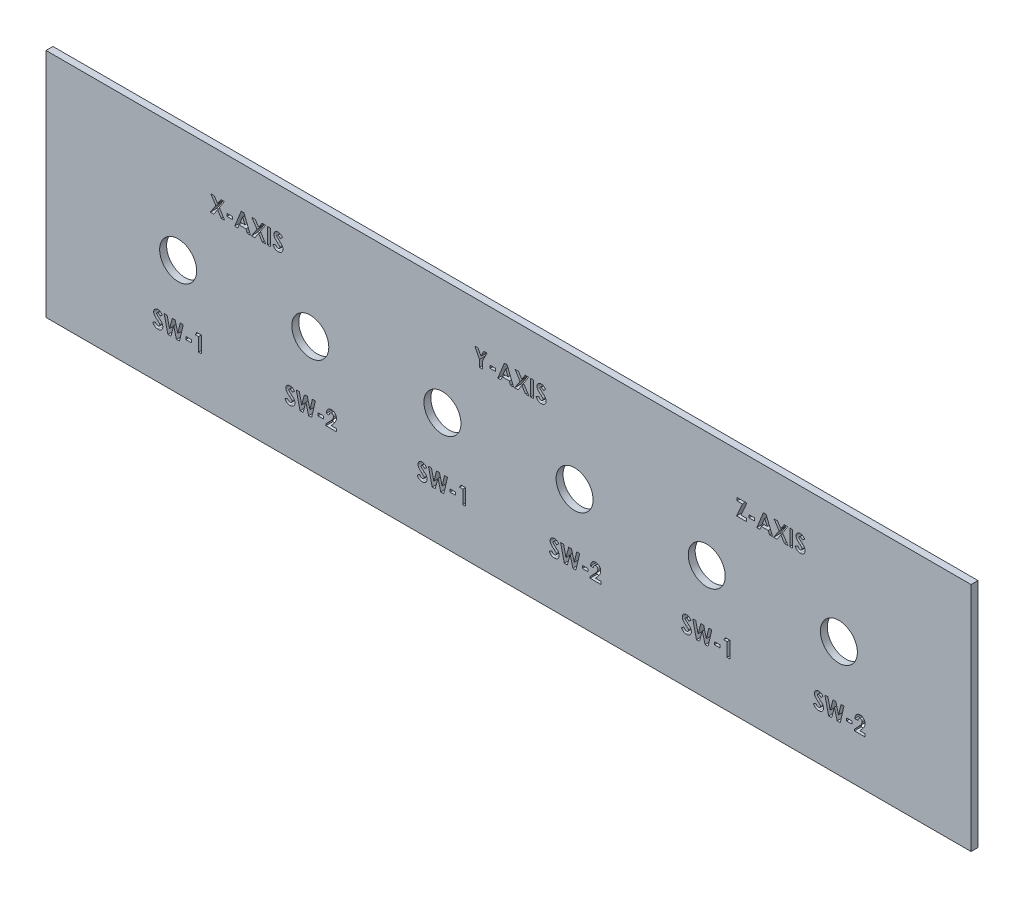
from build123d import *

# Parameters (mm, degrees)
SKETCH1_W           = 400
SKETCH1_H           = 100
BOSS_EXTRUDE1_DEPTH = 3
SKETCH2_R           = 8
SKETCH2_W           = 2.423076923
SKETCH2_H           = 1.166666667
SKETCH2_W_2         = 1.256410256
SKETCH2_H_2         = 7
SKETCH2_W_3         = 1.256410257
CUT_EXTRUDE1_DEPTH  = 207.177108332


with BuildPart() as part:
    # Sketch1 → Boss-Extrude1 (new body)
    with BuildSketch(Plane.XY):
        Rectangle(SKETCH1_W, SKETCH1_H)
    extrude(amount=BOSS_EXTRUDE1_DEPTH)

    # Sketch2 → Cut-Extrude1 (cut, through all)
    # profile 1 of 48: a face of its own
    with BuildSketch(Plane.XY.offset(3)):
        with Locations((-142.857142857, 0)):
            Circle(SKETCH2_R)
    # profile 2 of 48: a face of its own
    with BuildSketch(Plane.XY.offset(3)):
        with Locations((-85.717142857, 0)):
            Circle(SKETCH2_R)
    # profile 3 of 48: a face of its own
    with BuildSketch(Plane.XY.offset(3)):
        with Locations((-28.577142857, 0)):
            Circle(SKETCH2_R)
    # profile 4 of 48: a face of its own
    with BuildSketch(Plane.XY.offset(3)):
        with Locations((28.562857143, 0)):
            Circle(SKETCH2_R)
    # profile 5 of 48: a face of its own
    with BuildSketch(Plane.XY.offset(3)):
        with Locations((85.702857143, 0)):
            Circle(SKETCH2_R)
    # profile 6 of 48: a face of its own
    with BuildSketch(Plane.XY.offset(3)):
        with Locations((142.842857143, 0)):
            Circle(SKETCH2_R)
    # profile 7 of 48: a face of its own
    with BuildSketch(Plane.XY.offset(3)):
        Polygon((-128.759698947, 32), (-127.278929716, 32), (-125.816389652, 29.752203526), (-124.351045101, 32), (-122.868873626, 32), (-125.076005037, 28.614983974), (-122.723040293, 25), (-124.203809524, 25), (-125.816389652, 27.479166667), (-127.433176511, 25), (-128.915347985, 25), (-126.556774267, 28.616386218), align=None)
    # profile 8 of 48: a face of its own
    with BuildSketch(Plane.XY.offset(3)):
        with Locations((-120.56919414, 27.557692308)):
            Rectangle(SKETCH2_W, SKETCH2_H)
    # profile 9 of 48: a face of its own
    with BuildSketch(Plane.XY.offset(3)):
        Polygon((-115.587022665, 32), (-114.421758242, 32), (-111.594835165, 25), (-112.93678228, 25), (-113.480852793, 26.435897436), (-116.530732601, 26.435897436), (-117.074803114, 25), (-118.415347985, 25), align=None)
        Polygon((-115.005091575, 30.122395833), (-116.05396978, 27.692307692), (-113.95621337, 27.692307692), align=None, mode=Mode.SUBTRACT)
    # profile 10 of 48: a face of its own
    with BuildSketch(Plane.XY.offset(3)):
        Polygon((-110.990468178, 32), (-109.509698947, 32), (-108.047158883, 29.752203526), (-106.581814332, 32), (-105.099642857, 32), (-107.306774267, 28.614983974), (-104.953809524, 25), (-106.434578755, 25), (-108.047158883, 27.479166667), (-109.663945742, 25), (-111.146117216, 25), (-108.787543498, 28.616386218), align=None)
    # profile 11 of 48: a face of its own
    with BuildSketch(Plane.XY.offset(3)):
        with Locations((-103.562783883, 28.5)):
            Rectangle(SKETCH2_W_2, SKETCH2_H_2)
    # profile 12 of 48: a face of its own
    with BuildSketch(Plane.XY.offset(3)):
        with BuildLine():
            Line((-97.729450549, 31.064703526), (-98.668953755, 30.205128205))
            add(Edge.make_bspline(
                [(-98.668953755, 30.205128205), (-98.709198043, 30.261896958), (-98.786461466, 30.370885048), (-98.911697414, 30.516822668), (-99.036367858, 30.641318319), (-99.161627794, 30.743851915), (-99.288587477, 30.823800488), (-99.417026525, 30.880404961), (-99.54621678, 30.916388962), (-99.633012689, 30.920869836), (-99.675764652, 30.923076923)],
                knots=[0, 0, 0, 0, 1.299362458, 2.494594718, 3.587462134, 4.587049575, 5.512617175, 6.380583204, 7.202344345, 8, 8, 8, 8], degree=3))
            add(Edge.make_bspline(
                [(-99.675764652, 30.923076923), (-99.715642457, 30.921678411), (-99.792636022, 30.918978252), (-99.90239606, 30.892138875), (-99.999842586, 30.84581805), (-100.084880494, 30.785249675), (-100.152243064, 30.712278825), (-100.206026852, 30.635751166), (-100.236311644, 30.551281937), (-100.240297719, 30.493265063), (-100.242271062, 30.464543269)],
                knots=[0, 0, 0, 0, 1.185010067, 2.2879431, 3.333075148, 4.379039566, 5.372662701, 6.27520591, 7.14612461, 8, 8, 8, 8], degree=3))
            add(Edge.make_bspline(
                [(-100.242271062, 30.464543269), (-100.241034468, 30.435407294), (-100.238544139, 30.376731489), (-100.214490951, 30.29073479), (-100.178235929, 30.206706004), (-100.143592776, 30.155553683), (-100.125884844, 30.129407051)],
                knots=[0, 0, 0, 0, 0.967525499, 1.948461899, 2.951351359, 4, 4, 4, 4], degree=3))
            add(Edge.make_bspline(
                [(-100.125884844, 30.129407051), (-100.109786419, 30.109083548), (-100.07272997, 30.062301527), (-100.002070912, 29.988206099), (-99.913337974, 29.897432714), (-99.803116527, 29.793102802), (-99.675982166, 29.671464252), (-99.526042049, 29.537298722), (-99.357612106, 29.386451262), (-99.237896005, 29.281406552), (-99.17516369, 29.226362179)],
                knots=[0, 0, 0, 0, 0.473873513, 1.090794244, 1.870441696, 2.795289791, 3.865433203, 5.087734844, 6.473946851, 8, 8, 8, 8], degree=3))
            add(Edge.make_bspline(
                [(-99.17516369, 29.226362179), (-99.11628039, 29.175401653), (-99.004532118, 29.07868916), (-98.845536518, 28.941421305), (-98.705805867, 28.817924763), (-98.583304606, 28.710052952), (-98.479889737, 28.616674051), (-98.395126502, 28.53734171), (-98.327979662, 28.473600383), (-98.289810616, 28.435100582), (-98.273521062, 28.418669872)],
                knots=[0, 0, 0, 0, 1.543621617, 2.929473131, 4.163658386, 5.240097082, 6.164993805, 6.925417477, 7.541396219, 8, 8, 8, 8], degree=3))
            add(Edge.make_bspline(
                [(-98.273521062, 28.418669872), (-98.211721893, 28.351789936), (-98.092922188, 28.223223211), (-97.93852445, 28.023985221), (-97.811450118, 27.829488318), (-97.713143004, 27.636072726), (-97.638897519, 27.440947843), (-97.586553467, 27.239328243), (-97.555204267, 27.029107127), (-97.551723774, 26.885656878), (-97.54996337, 26.813100962)],
                knots=[0, 0, 0, 0, 1.206664779, 2.319633467, 3.337109185, 4.282041471, 5.190008762, 6.099243693, 7.03861361, 8, 8, 8, 8], degree=3))
            add(Edge.make_bspline(
                [(-97.54996337, 26.813100962), (-97.55121638, 26.742404119), (-97.553674833, 26.603694282), (-97.583786169, 26.400713097), (-97.626723166, 26.206451294), (-97.693111295, 26.023022715), (-97.774024754, 25.847416437), (-97.875461461, 25.682367846), (-97.994584965, 25.526206584), (-98.131118791, 25.381724223), (-98.282141415, 25.250616496), (-98.444127532, 25.1339013), (-98.618661124, 25.03753804), (-98.804251003, 24.958189768), (-99.000797828, 24.897074668), (-99.208067452, 24.851904913), (-99.426376907, 24.824794738), (-99.575660059, 24.821960691), (-99.651926511, 24.820512821)],
                knots=[0, 0, 0, 0, 1.043214005, 2.046824704, 3.02475056, 3.976699089, 4.921714032, 5.875962561, 6.831408892, 7.817874052, 8.806269674, 9.781291748, 10.760897367, 11.74438705, 12.757449933, 13.795994037, 14.874007457, 16, 16, 16, 16], degree=3))
            add(Edge.make_bspline(
                [(-99.651926511, 24.820512821), (-99.711795027, 24.821574928), (-99.830369022, 24.82367851), (-100.005129165, 24.840852503), (-100.173879838, 24.868569501), (-100.33643096, 24.908296239), (-100.493514851, 24.958635404), (-100.645137963, 25.020122766), (-100.790253591, 25.093711356), (-100.929959749, 25.1778879), (-101.063577292, 25.275627955), (-101.192795762, 25.384933258), (-101.316331638, 25.507484974), (-101.434778238, 25.642993272), (-101.547377707, 25.79184188), (-101.657815831, 25.951957804), (-101.761184406, 26.126312581), (-101.825039774, 26.248623867), (-101.857655678, 26.311097756)],
                knots=[0, 0, 0, 0, 1.016823716, 2.013894106, 2.979844003, 3.91962641, 4.853723003, 5.779685073, 6.695824784, 7.614987388, 8.547259901, 9.504950863, 10.487499108, 11.500346958, 12.559593716, 13.656357062, 14.802919212, 16, 16, 16, 16], degree=3))
            Line((-101.857655678, 26.311097756), (-100.752687729, 26.974358974))
            add(Edge.make_bspline(
                [(-100.752687729, 26.974358974), (-100.711890108, 26.903442947), (-100.633677581, 26.767490861), (-100.501139142, 26.584822003), (-100.365360278, 26.428396363), (-100.223201903, 26.300978775), (-100.07639261, 26.200865502), (-99.924223275, 26.129317611), (-99.766586987, 26.085029548), (-99.659212309, 26.079620952), (-99.605652473, 26.076923077)],
                knots=[0, 0, 0, 0, 1.283663364, 2.460892379, 3.537111102, 4.529833553, 5.449777664, 6.316464042, 7.160231139, 8, 8, 8, 8], degree=3))
            add(Edge.make_bspline(
                [(-99.605652473, 26.076923077), (-99.551174451, 26.079126308), (-99.445479154, 26.083400898), (-99.294612643, 26.122883992), (-99.156292514, 26.184875346), (-99.036729615, 26.273328461), (-98.935491291, 26.375416799), (-98.860771597, 26.488994743), (-98.813832181, 26.611883336), (-98.808869547, 26.697249837), (-98.806373626, 26.740184295)],
                knots=[0, 0, 0, 0, 1.13588714, 2.203786484, 3.234766741, 4.283437687, 5.291419208, 6.222934724, 7.106237994, 8, 8, 8, 8], degree=3))
            add(Edge.make_bspline(
                [(-98.806373626, 26.740184295), (-98.808678507, 26.780127821), (-98.813360651, 26.861269272), (-98.847847883, 26.981913561), (-98.901761945, 27.102502983), (-98.965546083, 27.20141369), (-99.030454429, 27.284228944), (-99.092521449, 27.355984615), (-99.16810266, 27.435262069), (-99.257006422, 27.522161032), (-99.358058084, 27.617446496), (-99.47134277, 27.721109132), (-99.598157708, 27.832235795), (-99.687790757, 27.907934181), (-99.734658883, 27.947516026)],
                knots=[0, 0, 0, 0, 0.916159276, 1.861089862, 2.860218735, 3.940849679, 4.552606315, 5.27541173, 6.11797699, 7.06649574, 8.129236253, 9.306560635, 10.591630461, 12, 12, 12, 12], degree=3))
            add(Edge.make_bspline(
                [(-99.734658883, 27.947516026), (-99.823757056, 28.022901624), (-99.994763417, 28.167589404), (-100.236417102, 28.3812887), (-100.45416871, 28.581010274), (-100.646137503, 28.76922312), (-100.814769461, 28.942451383), (-100.958922536, 29.10210209), (-101.07701314, 29.249406727), (-101.201278038, 29.423879212), (-101.319354535, 29.636485924), (-101.421406136, 29.892276445), (-101.487612908, 30.14803451), (-101.495030456, 30.319736388), (-101.498681319, 30.404246795)],
                knots=[0, 0, 0, 0, 1.345494975, 2.582412109, 3.71882943, 4.751509156, 5.681369928, 6.505683931, 7.230279997, 7.856715994, 8.973648664, 10.023341002, 11.027102913, 12, 12, 12, 12], degree=3))
            add(Edge.make_bspline(
                [(-101.498681319, 30.404246795), (-101.49716293, 30.46417704), (-101.49417154, 30.582246059), (-101.467487886, 30.75584935), (-101.427608147, 30.923361939), (-101.369691318, 31.084172663), (-101.294522266, 31.238080101), (-101.203232373, 31.385837695), (-101.094404079, 31.526085518), (-100.971761939, 31.658730593), (-100.836641701, 31.779953098), (-100.692248554, 31.886944105), (-100.539399778, 31.977310265), (-100.379030424, 32.052275556), (-100.21014675, 32.109656724), (-100.033992913, 32.150331357), (-99.850316253, 32.174523331), (-99.725383354, 32.177811949), (-99.661742216, 32.179487179)],
                knots=[0, 0, 0, 0, 1.010766082, 1.991317756, 2.957454644, 3.913069143, 4.869106762, 5.843196583, 6.838735724, 7.860187025, 8.887984031, 9.89767229, 10.887916223, 11.879572884, 12.879850636, 13.892031539, 14.926195476, 16, 16, 16, 16], degree=3))
            add(Edge.make_bspline(
                [(-99.661742216, 32.179487179), (-99.579266451, 32.17647004), (-99.414965955, 32.170459578), (-99.172042934, 32.123459728), (-98.934765883, 32.049547513), (-98.743563588, 31.960380557), (-98.591427492, 31.874004485), (-98.474829385, 31.794480278), (-98.356184535, 31.703381025), (-98.234536146, 31.600419648), (-98.112144632, 31.483656219), (-97.985529817, 31.355870384), (-97.856416983, 31.215957775), (-97.772514112, 31.116004855), (-97.729450549, 31.064703526)],
                knots=[0, 0, 0, 0, 1.282922637, 2.555718331, 3.837320111, 5.142675274, 5.830281639, 6.55870424, 7.337177975, 8.157850921, 9.037902056, 9.96903443, 10.957596896, 12, 12, 12, 12], degree=3))
        make_face()
    # profile 13 of 48: a face of its own
    with BuildSketch(Plane.XY.offset(3)):
        Polygon((-14.583333333, 32), (-13.185296474, 32), (-11.935897436, 29.544671474), (-10.686498397, 32), (-9.288461538, 32), (-11.307692308, 28.031650641), (-11.307692308, 25), (-12.564102564, 25), (-12.564102564, 28.031650641), align=None)
    # profile 14 of 48: a face of its own
    with BuildSketch(Plane.XY.offset(3)):
        with Locations((-6.775641026, 27.557692308)):
            Rectangle(SKETCH2_W, SKETCH2_H)
    # profile 15 of 48: a face of its own
    with BuildSketch(Plane.XY.offset(3)):
        Polygon((-1.793469551, 32), (-0.628205128, 32), (2.198717949, 25), (0.856770833, 25), (0.312700321, 26.435897436), (-2.737179487, 26.435897436), (-3.28125, 25), (-4.621794872, 25), align=None)
        Polygon((-1.211538462, 30.122395833), (-2.260416667, 27.692307692), (-0.162660256, 27.692307692), align=None, mode=Mode.SUBTRACT)
    # profile 16 of 48: a face of its own
    with BuildSketch(Plane.XY.offset(3)):
        Polygon((2.803084936, 32), (4.283854167, 32), (5.746394231, 29.752203526), (7.211738782, 32), (8.693910256, 32), (6.486778846, 28.614983974), (8.83974359, 25), (7.358974359, 25), (5.746394231, 27.479166667), (4.129607372, 25), (2.647435897, 25), (5.006009615, 28.616386218), align=None)
    # profile 17 of 48: a face of its own
    with BuildSketch(Plane.XY.offset(3)):
        with Locations((10.230769231, 28.5)):
            Rectangle(SKETCH2_W_2, SKETCH2_H_2)
    # profile 18 of 48: a face of its own
    with BuildSketch(Plane.XY.offset(3)):
        with BuildLine():
            Line((16.064102564, 31.064703526), (15.124599359, 30.205128205))
            add(Edge.make_bspline(
                [(15.124599359, 30.205128205), (15.08435507, 30.261896958), (15.007091648, 30.370885048), (14.881855699, 30.516822668), (14.757185255, 30.641318319), (14.63192532, 30.743851915), (14.504965636, 30.823800488), (14.376526589, 30.880404961), (14.247336334, 30.916388962), (14.160540425, 30.920869836), (14.117788462, 30.923076923)],
                knots=[0, 0, 0, 0, 1.299362458, 2.494594718, 3.587462134, 4.587049575, 5.512617175, 6.380583204, 7.202344345, 8, 8, 8, 8], degree=3))
            add(Edge.make_bspline(
                [(14.117788462, 30.923076923), (14.077910656, 30.921678411), (14.000917092, 30.918978252), (13.891157053, 30.892138875), (13.793710528, 30.84581805), (13.708672619, 30.785249675), (13.64131005, 30.712278825), (13.587526261, 30.635751166), (13.557241469, 30.551281937), (13.553255395, 30.493265063), (13.551282051, 30.464543269)],
                knots=[0, 0, 0, 0, 1.185010067, 2.2879431, 3.333075148, 4.379039566, 5.372662701, 6.27520591, 7.14612461, 8, 8, 8, 8], degree=3))
            add(Edge.make_bspline(
                [(13.551282051, 30.464543269), (13.552518646, 30.435407294), (13.555008974, 30.376731489), (13.579062162, 30.29073479), (13.615317184, 30.206706004), (13.649960338, 30.155553683), (13.667668269, 30.129407051)],
                knots=[0, 0, 0, 0, 0.967525499, 1.948461899, 2.951351359, 4, 4, 4, 4], degree=3))
            add(Edge.make_bspline(
                [(13.667668269, 30.129407051), (13.683766694, 30.109083548), (13.720823143, 30.062301527), (13.791482202, 29.988206099), (13.880215139, 29.897432714), (13.990436586, 29.793102802), (14.117570948, 29.671464252), (14.267511065, 29.537298722), (14.435941008, 29.386451262), (14.555657109, 29.281406552), (14.618389423, 29.226362179)],
                knots=[0, 0, 0, 0, 0.473873513, 1.090794244, 1.870441696, 2.795289791, 3.865433203, 5.087734844, 6.473946851, 8, 8, 8, 8], degree=3))
            add(Edge.make_bspline(
                [(14.618389423, 29.226362179), (14.677272724, 29.175401653), (14.789020996, 29.07868916), (14.948016595, 28.941421305), (15.087747247, 28.817924763), (15.210248507, 28.710052952), (15.313663376, 28.616674051), (15.398426611, 28.53734171), (15.465573451, 28.473600383), (15.503742498, 28.435100582), (15.520032051, 28.418669872)],
                knots=[0, 0, 0, 0, 1.543621617, 2.929473131, 4.163658386, 5.240097082, 6.164993805, 6.925417477, 7.541396219, 8, 8, 8, 8], degree=3))
            add(Edge.make_bspline(
                [(15.520032051, 28.418669872), (15.58183122, 28.351789936), (15.700630926, 28.223223211), (15.855028664, 28.023985221), (15.982102996, 27.829488318), (16.080410109, 27.636072726), (16.154655595, 27.440947843), (16.206999646, 27.239328243), (16.238348847, 27.029107127), (16.24182934, 26.885656878), (16.243589744, 26.813100962)],
                knots=[0, 0, 0, 0, 1.206664779, 2.319633467, 3.337109185, 4.282041471, 5.190008762, 6.099243693, 7.03861361, 8, 8, 8, 8], degree=3))
            add(Edge.make_bspline(
                [(16.243589744, 26.813100962), (16.242336733, 26.742404119), (16.23987828, 26.603694282), (16.209766945, 26.400713097), (16.166829948, 26.206451294), (16.100441818, 26.023022715), (16.019528359, 25.847416437), (15.918091652, 25.682367846), (15.798968148, 25.526206584), (15.662434323, 25.381724223), (15.511411699, 25.250616496), (15.349425582, 25.1339013), (15.17489199, 25.03753804), (14.98930211, 24.958189768), (14.792755286, 24.897074668), (14.585485662, 24.851904913), (14.367176206, 24.824794738), (14.217893055, 24.821960691), (14.141626603, 24.820512821)],
                knots=[0, 0, 0, 0, 1.043214005, 2.046824704, 3.02475056, 3.976699089, 4.921714032, 5.875962561, 6.831408892, 7.817874052, 8.806269674, 9.781291748, 10.760897367, 11.74438705, 12.757449933, 13.795994037, 14.874007457, 16, 16, 16, 16], degree=3))
            add(Edge.make_bspline(
                [(14.141626603, 24.820512821), (14.081758087, 24.821574928), (13.963184092, 24.82367851), (13.788423949, 24.840852503), (13.619673275, 24.868569501), (13.457122154, 24.908296239), (13.300038262, 24.958635404), (13.14841515, 25.020122766), (13.003299522, 25.093711356), (12.863593365, 25.1778879), (12.729975821, 25.275627955), (12.600757352, 25.384933258), (12.477221476, 25.507484974), (12.358774876, 25.642993272), (12.246175406, 25.79184188), (12.135737282, 25.951957804), (12.032368707, 26.126312581), (11.96851334, 26.248623867), (11.935897436, 26.311097756)],
                knots=[0, 0, 0, 0, 1.016823716, 2.013894106, 2.979844003, 3.91962641, 4.853723003, 5.779685073, 6.695824784, 7.614987388, 8.547259901, 9.504950863, 10.487499108, 11.500346958, 12.559593716, 13.656357062, 14.802919212, 16, 16, 16, 16], degree=3))
            Line((11.935897436, 26.311097756), (13.040865385, 26.974358974))
            add(Edge.make_bspline(
                [(13.040865385, 26.974358974), (13.081663006, 26.903442947), (13.159875533, 26.767490861), (13.292413971, 26.584822003), (13.428192835, 26.428396363), (13.57035121, 26.300978775), (13.717160504, 26.200865502), (13.869329839, 26.129317611), (14.026966126, 26.085029548), (14.134340804, 26.079620952), (14.187900641, 26.076923077)],
                knots=[0, 0, 0, 0, 1.283663364, 2.460892379, 3.537111102, 4.529833553, 5.449777664, 6.316464042, 7.160231139, 8, 8, 8, 8], degree=3))
            add(Edge.make_bspline(
                [(14.187900641, 26.076923077), (14.242378663, 26.079126308), (14.34807396, 26.083400898), (14.49894047, 26.122883992), (14.6372606, 26.184875346), (14.756823498, 26.273328461), (14.858061822, 26.375416799), (14.932781516, 26.488994743), (14.979720932, 26.611883336), (14.984683566, 26.697249837), (14.987179487, 26.740184295)],
                knots=[0, 0, 0, 0, 1.13588714, 2.203786484, 3.234766741, 4.283437687, 5.291419208, 6.222934724, 7.106237994, 8, 8, 8, 8], degree=3))
            add(Edge.make_bspline(
                [(14.987179487, 26.740184295), (14.984874607, 26.780127821), (14.980192462, 26.861269272), (14.945705231, 26.981913561), (14.891791168, 27.102502983), (14.828007031, 27.20141369), (14.763098684, 27.284228944), (14.701031665, 27.355984615), (14.625450454, 27.435262069), (14.536546691, 27.522161032), (14.435495029, 27.617446496), (14.322210344, 27.721109132), (14.195395405, 27.832235795), (14.105762357, 27.907934181), (14.058894231, 27.947516026)],
                knots=[0, 0, 0, 0, 0.916159276, 1.861089862, 2.860218735, 3.940849679, 4.552606315, 5.27541173, 6.11797699, 7.06649574, 8.129236253, 9.306560635, 10.591630461, 12, 12, 12, 12], degree=3))
            add(Edge.make_bspline(
                [(14.058894231, 27.947516026), (13.969796058, 28.022901624), (13.798789696, 28.167589404), (13.557136011, 28.3812887), (13.339384404, 28.581010274), (13.147415611, 28.76922312), (12.978783652, 28.942451383), (12.834630577, 29.10210209), (12.716539973, 29.249406727), (12.592275076, 29.423879212), (12.474198578, 29.636485924), (12.372146977, 29.892276445), (12.305940206, 30.14803451), (12.298522658, 30.319736388), (12.294871795, 30.404246795)],
                knots=[0, 0, 0, 0, 1.345494975, 2.582412109, 3.71882943, 4.751509156, 5.681369928, 6.505683931, 7.230279997, 7.856715994, 8.973648664, 10.023341002, 11.027102913, 12, 12, 12, 12], degree=3))
            add(Edge.make_bspline(
                [(12.294871795, 30.404246795), (12.296390184, 30.46417704), (12.299381573, 30.582246059), (12.326065228, 30.75584935), (12.365944966, 30.923361939), (12.423861796, 31.084172663), (12.499030847, 31.238080101), (12.59032074, 31.385837695), (12.699149034, 31.526085518), (12.821791174, 31.658730593), (12.956911413, 31.779953098), (13.101304559, 31.886944105), (13.254153335, 31.977310265), (13.414522689, 32.052275556), (13.583406364, 32.109656724), (13.759560201, 32.150331357), (13.94323686, 32.174523331), (14.068169759, 32.177811949), (14.131810897, 32.179487179)],
                knots=[0, 0, 0, 0, 1.010766082, 1.991317756, 2.957454644, 3.913069143, 4.869106762, 5.843196583, 6.838735724, 7.860187025, 8.887984031, 9.89767229, 10.887916223, 11.879572884, 12.879850636, 13.892031539, 14.926195476, 16, 16, 16, 16], degree=3))
            add(Edge.make_bspline(
                [(14.131810897, 32.179487179), (14.214286663, 32.17647004), (14.378587158, 32.170459578), (14.62151018, 32.123459728), (14.858787231, 32.049547513), (15.049989525, 31.960380557), (15.202125622, 31.874004485), (15.318723729, 31.794480278), (15.437368578, 31.703381025), (15.559016968, 31.600419648), (15.681408482, 31.483656219), (15.808023297, 31.355870384), (15.937136131, 31.215957775), (16.021039002, 31.116004855), (16.064102564, 31.064703526)],
                knots=[0, 0, 0, 0, 1.282922637, 2.555718331, 3.837320111, 5.142675274, 5.830281639, 6.55870424, 7.337177975, 8.157850921, 9.037902056, 9.96903443, 10.957596896, 12, 12, 12, 12], degree=3))
        make_face()
    # profile 19 of 48: a face of its own
    with BuildSketch(Plane.XY.offset(3)):
        with BuildLine():
            Line((128.062783883, 31.064703526), (127.123280678, 30.205128205))
            add(Edge.make_bspline(
                [(127.123280678, 30.205128205), (127.083036389, 30.261896958), (127.005772967, 30.370885048), (126.880537018, 30.516822668), (126.755866574, 30.641318319), (126.630606638, 30.743851915), (126.503646955, 30.823800488), (126.375207908, 30.880404961), (126.246017653, 30.916388962), (126.159221744, 30.920869836), (126.11646978, 30.923076923)],
                knots=[0, 0, 0, 0, 1.299362458, 2.494594718, 3.587462134, 4.587049575, 5.512617175, 6.380583204, 7.202344345, 8, 8, 8, 8], degree=3))
            add(Edge.make_bspline(
                [(126.11646978, 30.923076923), (126.076591975, 30.921678411), (125.99959841, 30.918978252), (125.889838372, 30.892138875), (125.792391847, 30.84581805), (125.707353938, 30.785249675), (125.639991368, 30.712278825), (125.58620758, 30.635751166), (125.555922788, 30.551281937), (125.551936713, 30.493265063), (125.54996337, 30.464543269)],
                knots=[0, 0, 0, 0, 1.185010067, 2.2879431, 3.333075148, 4.379039566, 5.372662701, 6.27520591, 7.14612461, 8, 8, 8, 8], degree=3))
            add(Edge.make_bspline(
                [(125.54996337, 30.464543269), (125.551199964, 30.435407294), (125.553690293, 30.376731489), (125.577743481, 30.29073479), (125.613998503, 30.206706004), (125.648641656, 30.155553683), (125.666349588, 30.129407051)],
                knots=[0, 0, 0, 0, 0.967525499, 1.948461899, 2.951351359, 4, 4, 4, 4], degree=3))
            add(Edge.make_bspline(
                [(125.666349588, 30.129407051), (125.682448013, 30.109083548), (125.719504462, 30.062301527), (125.79016352, 29.988206099), (125.878896458, 29.897432714), (125.989117905, 29.793102802), (126.116252266, 29.671464252), (126.266192383, 29.537298722), (126.434622326, 29.386451262), (126.554338427, 29.281406552), (126.617070742, 29.226362179)],
                knots=[0, 0, 0, 0, 0.473873513, 1.090794244, 1.870441696, 2.795289791, 3.865433203, 5.087734844, 6.473946851, 8, 8, 8, 8], degree=3))
            add(Edge.make_bspline(
                [(126.617070742, 29.226362179), (126.675954043, 29.175401653), (126.787702314, 29.07868916), (126.946697914, 28.941421305), (127.086428565, 28.817924763), (127.208929826, 28.710052952), (127.312344695, 28.616674051), (127.39710793, 28.53734171), (127.46425477, 28.473600383), (127.502423817, 28.435100582), (127.51871337, 28.418669872)],
                knots=[0, 0, 0, 0, 1.543621617, 2.929473131, 4.163658386, 5.240097082, 6.164993805, 6.925417477, 7.541396219, 8, 8, 8, 8], degree=3))
            add(Edge.make_bspline(
                [(127.51871337, 28.418669872), (127.580512539, 28.351789936), (127.699312245, 28.223223211), (127.853709982, 28.023985221), (127.980784315, 27.829488318), (128.079091428, 27.636072726), (128.153336914, 27.440947843), (128.205680965, 27.239328243), (128.237030165, 27.029107127), (128.240510658, 26.885656878), (128.242271062, 26.813100962)],
                knots=[0, 0, 0, 0, 1.206664779, 2.319633467, 3.337109185, 4.282041471, 5.190008762, 6.099243693, 7.03861361, 8, 8, 8, 8], degree=3))
            add(Edge.make_bspline(
                [(128.242271062, 26.813100962), (128.241018052, 26.742404119), (128.238559599, 26.603694282), (128.208448263, 26.400713097), (128.165511267, 26.206451294), (128.099123137, 26.023022715), (128.018209678, 25.847416437), (127.916772971, 25.682367846), (127.797649467, 25.526206584), (127.661115641, 25.381724223), (127.510093018, 25.250616496), (127.348106901, 25.1339013), (127.173573309, 25.03753804), (126.987983429, 24.958189768), (126.791436604, 24.897074668), (126.584166981, 24.851904913), (126.365857525, 24.824794738), (126.216574373, 24.821960691), (126.140307921, 24.820512821)],
                knots=[0, 0, 0, 0, 1.043214005, 2.046824704, 3.02475056, 3.976699089, 4.921714032, 5.875962561, 6.831408892, 7.817874052, 8.806269674, 9.781291748, 10.760897367, 11.74438705, 12.757449933, 13.795994037, 14.874007457, 16, 16, 16, 16], degree=3))
            add(Edge.make_bspline(
                [(126.140307921, 24.820512821), (126.080439406, 24.821574928), (125.96186541, 24.82367851), (125.787105267, 24.840852503), (125.618354594, 24.868569501), (125.455803472, 24.908296239), (125.298719581, 24.958635404), (125.147096469, 25.020122766), (125.001980841, 25.093711356), (124.862274683, 25.1778879), (124.72865714, 25.275627955), (124.59943867, 25.384933258), (124.475902794, 25.507484974), (124.357456194, 25.642993272), (124.244856725, 25.79184188), (124.134418601, 25.951957804), (124.031050026, 26.126312581), (123.967194659, 26.248623867), (123.934578755, 26.311097756)],
                knots=[0, 0, 0, 0, 1.016823716, 2.013894106, 2.979844003, 3.91962641, 4.853723003, 5.779685073, 6.695824784, 7.614987388, 8.547259901, 9.504950863, 10.487499108, 11.500346958, 12.559593716, 13.656357062, 14.802919212, 16, 16, 16, 16], degree=3))
            Line((123.934578755, 26.311097756), (125.039546703, 26.974358974))
            add(Edge.make_bspline(
                [(125.039546703, 26.974358974), (125.080344325, 26.903442947), (125.158556851, 26.767490861), (125.29109529, 26.584822003), (125.426874154, 26.428396363), (125.569032529, 26.300978775), (125.715841822, 26.200865502), (125.868011157, 26.129317611), (126.025647445, 26.085029548), (126.133022123, 26.079620952), (126.18658196, 26.076923077)],
                knots=[0, 0, 0, 0, 1.283663364, 2.460892379, 3.537111102, 4.529833553, 5.449777664, 6.316464042, 7.160231139, 8, 8, 8, 8], degree=3))
            add(Edge.make_bspline(
                [(126.18658196, 26.076923077), (126.241059982, 26.079126308), (126.346755278, 26.083400898), (126.497621789, 26.122883992), (126.635941919, 26.184875346), (126.755504817, 26.273328461), (126.856743141, 26.375416799), (126.931462835, 26.488994743), (126.978402251, 26.611883336), (126.983364885, 26.697249837), (126.985860806, 26.740184295)],
                knots=[0, 0, 0, 0, 1.13588714, 2.203786484, 3.234766741, 4.283437687, 5.291419208, 6.222934724, 7.106237994, 8, 8, 8, 8], degree=3))
            add(Edge.make_bspline(
                [(126.985860806, 26.740184295), (126.983555925, 26.780127821), (126.978873781, 26.861269272), (126.944386549, 26.981913561), (126.890472487, 27.102502983), (126.82668835, 27.20141369), (126.761780003, 27.284228944), (126.699712983, 27.355984615), (126.624131772, 27.435262069), (126.53522801, 27.522161032), (126.434176348, 27.617446496), (126.320891662, 27.721109132), (126.194076724, 27.832235795), (126.104443675, 27.907934181), (126.057575549, 27.947516026)],
                knots=[0, 0, 0, 0, 0.916159276, 1.861089862, 2.860218735, 3.940849679, 4.552606315, 5.27541173, 6.11797699, 7.06649574, 8.129236253, 9.306560635, 10.591630461, 12, 12, 12, 12], degree=3))
            add(Edge.make_bspline(
                [(126.057575549, 27.947516026), (125.968477377, 28.022901624), (125.797471015, 28.167589404), (125.55581733, 28.3812887), (125.338065723, 28.581010274), (125.146096929, 28.76922312), (124.977464971, 28.942451383), (124.833311896, 29.10210209), (124.715221292, 29.249406727), (124.590956395, 29.423879212), (124.472879897, 29.636485924), (124.370828296, 29.892276445), (124.304621524, 30.14803451), (124.297203976, 30.319736388), (124.293553114, 30.404246795)],
                knots=[0, 0, 0, 0, 1.345494975, 2.582412109, 3.71882943, 4.751509156, 5.681369928, 6.505683931, 7.230279997, 7.856715994, 8.973648664, 10.023341002, 11.027102913, 12, 12, 12, 12], degree=3))
            add(Edge.make_bspline(
                [(124.293553114, 30.404246795), (124.295071503, 30.46417704), (124.298062892, 30.582246059), (124.324746547, 30.75584935), (124.364626285, 30.923361939), (124.422543114, 31.084172663), (124.497712166, 31.238080101), (124.589002059, 31.385837695), (124.697830353, 31.526085518), (124.820472493, 31.658730593), (124.955592732, 31.779953098), (125.099985878, 31.886944105), (125.252834654, 31.977310265), (125.413204008, 32.052275556), (125.582087683, 32.109656724), (125.75824152, 32.150331357), (125.941918179, 32.174523331), (126.066851078, 32.177811949), (126.130492216, 32.179487179)],
                knots=[0, 0, 0, 0, 1.010766082, 1.991317756, 2.957454644, 3.913069143, 4.869106762, 5.843196583, 6.838735724, 7.860187025, 8.887984031, 9.89767229, 10.887916223, 11.879572884, 12.879850636, 13.892031539, 14.926195476, 16, 16, 16, 16], degree=3))
            add(Edge.make_bspline(
                [(126.130492216, 32.179487179), (126.212967981, 32.17647004), (126.377268477, 32.170459578), (126.620191499, 32.123459728), (126.857468549, 32.049547513), (127.048670844, 31.960380557), (127.200806941, 31.874004485), (127.317405047, 31.794480278), (127.436049897, 31.703381025), (127.557698287, 31.600419648), (127.680089801, 31.483656219), (127.806704616, 31.355870384), (127.935817449, 31.215957775), (128.01972032, 31.116004855), (128.062783883, 31.064703526)],
                knots=[0, 0, 0, 0, 1.282922637, 2.555718331, 3.837320111, 5.142675274, 5.830281639, 6.55870424, 7.337177975, 8.157850921, 9.037902056, 9.96903443, 10.957596896, 12, 12, 12, 12], degree=3))
        make_face()
    # profile 20 of 48: a face of its own
    with BuildSketch(Plane.XY.offset(3)):
        with Locations((122.22945055, 28.5)):
            Rectangle(SKETCH2_W_3, SKETCH2_H_2)
    # profile 21 of 48: a face of its own
    with BuildSketch(Plane.XY.offset(3)):
        Polygon((114.801766255, 32), (116.282535485, 32), (117.745075549, 29.752203526), (119.210420101, 32), (120.692591575, 32), (118.485460165, 28.614983974), (120.838424908, 25), (119.357655678, 25), (117.745075549, 27.479166667), (116.12828869, 25), (114.646117216, 25), (117.004690934, 28.616386218), align=None)
    # profile 22 of 48: a face of its own
    with BuildSketch(Plane.XY.offset(3)):
        Polygon((110.205211767, 32), (111.37047619, 32), (114.197399267, 25), (112.855452152, 25), (112.311381639, 26.435897436), (109.261501832, 26.435897436), (108.717431319, 25), (107.376886447, 25), align=None)
        Polygon((110.787142857, 30.122395833), (109.738264652, 27.692307692), (111.836021062, 27.692307692), align=None, mode=Mode.SUBTRACT)
    # profile 23 of 48: a face of its own
    with BuildSketch(Plane.XY.offset(3)):
        with Locations((105.223040294, 27.557692308)):
            Rectangle(SKETCH2_W, SKETCH2_H)
    # profile 24 of 48: a face of its own
    with BuildSketch(Plane.XY.offset(3)):
        Polygon((98.806373626, 32), (103.024322344, 32), (100.517110806, 26.256410256), (102.844835165, 26.256410256), (102.844835165, 25), (98.626886447, 25), (101.135500229, 30.743589744), (98.806373626, 30.743589744), align=None)
    # profile 25 of 48: a face of its own
    with BuildSketch(Plane.XY.offset(3)):
        with BuildLine():
            Line((-149.677655678, -23.935296474), (-150.617158883, -24.794871795))
            add(Edge.make_bspline(
                [(-150.617158883, -24.794871795), (-150.657403172, -24.738103042), (-150.734666594, -24.629114952), (-150.859902543, -24.483177332), (-150.984572987, -24.358681681), (-151.109832922, -24.256148085), (-151.236792605, -24.176199512), (-151.365231653, -24.119595039), (-151.494421908, -24.083611038), (-151.581217817, -24.079130164), (-151.62396978, -24.076923077)],
                knots=[0, 0, 0, 0, 1.299362458, 2.494594718, 3.587462134, 4.587049575, 5.512617175, 6.380583204, 7.202344345, 8, 8, 8, 8], degree=3))
            add(Edge.make_bspline(
                [(-151.62396978, -24.076923077), (-151.663847585, -24.078321589), (-151.74084115, -24.081021748), (-151.850601188, -24.107861125), (-151.948047714, -24.15418195), (-152.033085622, -24.214750325), (-152.100448192, -24.287721175), (-152.15423198, -24.364248834), (-152.184516773, -24.448718063), (-152.188502847, -24.506734937), (-152.19047619, -24.535456731)],
                knots=[0, 0, 0, 0, 1.185010067, 2.2879431, 3.333075148, 4.379039566, 5.372662701, 6.27520591, 7.14612461, 8, 8, 8, 8], degree=3))
            add(Edge.make_bspline(
                [(-152.19047619, -24.535456731), (-152.189239596, -24.564592706), (-152.186749267, -24.623268511), (-152.16269608, -24.70926521), (-152.126441058, -24.793293996), (-152.091797904, -24.844446317), (-152.074089973, -24.870592949)],
                knots=[0, 0, 0, 0, 0.967525499, 1.948461899, 2.951351359, 4, 4, 4, 4], degree=3))
            add(Edge.make_bspline(
                [(-152.074089973, -24.870592949), (-152.057991547, -24.890916452), (-152.020935098, -24.937698473), (-151.95027604, -25.011793901), (-151.861543103, -25.102567286), (-151.751321656, -25.206897198), (-151.624187294, -25.328535748), (-151.474247177, -25.462701278), (-151.305817234, -25.613548738), (-151.186101133, -25.718593448), (-151.123368819, -25.773637821)],
                knots=[0, 0, 0, 0, 0.473873513, 1.090794244, 1.870441696, 2.795289791, 3.865433203, 5.087734844, 6.473946851, 8, 8, 8, 8], degree=3))
            add(Edge.make_bspline(
                [(-151.123368819, -25.773637821), (-151.064485518, -25.824598347), (-150.952737246, -25.92131084), (-150.793741646, -26.058578695), (-150.654010995, -26.182075237), (-150.531509735, -26.289947048), (-150.428094865, -26.383325949), (-150.34333163, -26.46265829), (-150.276184791, -26.526399617), (-150.238015744, -26.564899418), (-150.22172619, -26.581330128)],
                knots=[0, 0, 0, 0, 1.543621617, 2.929473131, 4.163658386, 5.240097082, 6.164993805, 6.925417477, 7.541396219, 8, 8, 8, 8], degree=3))
            add(Edge.make_bspline(
                [(-150.22172619, -26.581330128), (-150.159927022, -26.648210064), (-150.041127316, -26.776776789), (-149.886729578, -26.976014779), (-149.759655246, -27.170511682), (-149.661348133, -27.363927274), (-149.587102647, -27.559052157), (-149.534758596, -27.760671757), (-149.503409395, -27.970892873), (-149.499928902, -28.114343122), (-149.498168498, -28.186899038)],
                knots=[0, 0, 0, 0, 1.206664779, 2.319633467, 3.337109185, 4.282041471, 5.190008762, 6.099243693, 7.03861361, 8, 8, 8, 8], degree=3))
            add(Edge.make_bspline(
                [(-149.498168498, -28.186899038), (-149.499421509, -28.257595881), (-149.501879962, -28.396305718), (-149.531991297, -28.599286903), (-149.574928294, -28.793548706), (-149.641316423, -28.976977285), (-149.722229882, -29.152583563), (-149.82366659, -29.317632154), (-149.942790093, -29.473793416), (-150.079323919, -29.618275777), (-150.230346543, -29.749383504), (-150.39233266, -29.8660987), (-150.566866252, -29.96246196), (-150.752456131, -30.041810232), (-150.949002956, -30.102925332), (-151.15627258, -30.148095087), (-151.374582035, -30.175205262), (-151.523865187, -30.178039309), (-151.600131639, -30.179487179)],
                knots=[0, 0, 0, 0, 1.043214005, 2.046824704, 3.02475056, 3.976699089, 4.921714032, 5.875962561, 6.831408892, 7.817874052, 8.806269674, 9.781291748, 10.760897367, 11.74438705, 12.757449933, 13.795994037, 14.874007457, 16, 16, 16, 16], degree=3))
            add(Edge.make_bspline(
                [(-151.600131639, -30.179487179), (-151.660000155, -30.178425072), (-151.77857415, -30.17632149), (-151.953334293, -30.159147497), (-152.122084967, -30.131430499), (-152.284636088, -30.091703761), (-152.441719979, -30.041364596), (-152.593343091, -29.979877234), (-152.738458719, -29.906288644), (-152.878164877, -29.8221121), (-153.01178242, -29.724372045), (-153.14100089, -29.615066742), (-153.264536766, -29.492515026), (-153.382983366, -29.357006728), (-153.495582836, -29.20815812), (-153.606020959, -29.048042196), (-153.709389535, -28.873687419), (-153.773244902, -28.751376133), (-153.805860806, -28.688902244)],
                knots=[0, 0, 0, 0, 1.016823716, 2.013894106, 2.979844003, 3.91962641, 4.853723003, 5.779685073, 6.695824784, 7.614987388, 8.547259901, 9.504950863, 10.487499108, 11.500346958, 12.559593716, 13.656357062, 14.802919212, 16, 16, 16, 16], degree=3))
            Line((-153.805860806, -28.688902244), (-152.700892857, -28.025641026))
            add(Edge.make_bspline(
                [(-152.700892857, -28.025641026), (-152.660095236, -28.096557053), (-152.581882709, -28.232509139), (-152.449344271, -28.415177997), (-152.313565407, -28.571603637), (-152.171407032, -28.699021225), (-152.024597738, -28.799134498), (-151.872428403, -28.870682389), (-151.714792115, -28.914970452), (-151.607417437, -28.920379048), (-151.553857601, -28.923076923)],
                knots=[0, 0, 0, 0, 1.283663364, 2.460892379, 3.537111102, 4.529833553, 5.449777664, 6.316464042, 7.160231139, 8, 8, 8, 8], degree=3))
            add(Edge.make_bspline(
                [(-151.553857601, -28.923076923), (-151.499379579, -28.920873692), (-151.393684282, -28.916599102), (-151.242817771, -28.877116008), (-151.104497642, -28.815124654), (-150.984934743, -28.726671539), (-150.88369642, -28.624583201), (-150.808976725, -28.511005257), (-150.76203731, -28.388116664), (-150.757074675, -28.302750163), (-150.754578755, -28.259815705)],
                knots=[0, 0, 0, 0, 1.13588714, 2.203786484, 3.234766741, 4.283437687, 5.291419208, 6.222934724, 7.106237994, 8, 8, 8, 8], degree=3))
            add(Edge.make_bspline(
                [(-150.754578755, -28.259815705), (-150.756883635, -28.219872179), (-150.761565779, -28.138730728), (-150.796053011, -28.018086439), (-150.849967073, -27.897497017), (-150.913751211, -27.79858631), (-150.978659558, -27.715771056), (-151.040726577, -27.644015385), (-151.116307788, -27.564737931), (-151.20521155, -27.477838968), (-151.306263213, -27.382553504), (-151.419547898, -27.278890868), (-151.546362836, -27.167764205), (-151.635995885, -27.092065819), (-151.682864011, -27.052483974)],
                knots=[0, 0, 0, 0, 0.916159276, 1.861089862, 2.860218735, 3.940849679, 4.552606315, 5.27541173, 6.11797699, 7.06649574, 8.129236253, 9.306560635, 10.591630461, 12, 12, 12, 12], degree=3))
            add(Edge.make_bspline(
                [(-151.682864011, -27.052483974), (-151.771962184, -26.977098376), (-151.942968545, -26.832410596), (-152.18462223, -26.6187113), (-152.402373838, -26.418989726), (-152.594342631, -26.23077688), (-152.76297459, -26.057548617), (-152.907127664, -25.89789791), (-153.025218269, -25.750593273), (-153.149483166, -25.576120788), (-153.267559663, -25.363514076), (-153.369611265, -25.107723555), (-153.435818036, -24.85196549), (-153.443235584, -24.680263612), (-153.446886447, -24.595753205)],
                knots=[0, 0, 0, 0, 1.345494975, 2.582412109, 3.71882943, 4.751509156, 5.681369928, 6.505683931, 7.230279997, 7.856715994, 8.973648664, 10.023341002, 11.027102913, 12, 12, 12, 12], degree=3))
            add(Edge.make_bspline(
                [(-153.446886447, -24.595753205), (-153.445368058, -24.53582296), (-153.442376669, -24.417753941), (-153.415693014, -24.24415065), (-153.375813275, -24.076638061), (-153.317896446, -23.915827337), (-153.242727395, -23.761919899), (-153.151437502, -23.614162305), (-153.042609208, -23.473914482), (-152.919967067, -23.341269407), (-152.784846829, -23.220046902), (-152.640453683, -23.113055895), (-152.487604907, -23.022689735), (-152.327235552, -22.947724444), (-152.158351878, -22.890343276), (-151.982198041, -22.849668643), (-151.798521382, -22.825476669), (-151.673588483, -22.822188051), (-151.609947344, -22.820512821)],
                knots=[0, 0, 0, 0, 1.010766082, 1.991317756, 2.957454644, 3.913069143, 4.869106762, 5.843196583, 6.838735724, 7.860187025, 8.887984031, 9.89767229, 10.887916223, 11.879572884, 12.879850636, 13.892031539, 14.926195476, 16, 16, 16, 16], degree=3))
            add(Edge.make_bspline(
                [(-151.609947344, -22.820512821), (-151.527471579, -22.82352996), (-151.363171083, -22.829540422), (-151.120248062, -22.876540272), (-150.882971011, -22.950452487), (-150.691768717, -23.039619443), (-150.53963262, -23.125995515), (-150.423034513, -23.205519722), (-150.304389664, -23.296618975), (-150.182741274, -23.399580352), (-150.06034976, -23.516343781), (-149.933734945, -23.644129616), (-149.804622111, -23.784042225), (-149.72071924, -23.883995145), (-149.677655678, -23.935296474)],
                knots=[0, 0, 0, 0, 1.282922637, 2.555718331, 3.837320111, 5.142675274, 5.830281639, 6.55870424, 7.337177975, 8.157850921, 9.037902056, 9.96903443, 10.957596896, 12, 12, 12, 12], degree=3))
        make_face()
    # profile 26 of 48: a face of its own
    with BuildSketch(Plane.XY.offset(3)):
        Polygon((-148.914835165, -23), (-147.617759844, -23), (-146.581501832, -27.468950321), (-145.393801511, -23), (-144.172447344, -23), (-142.991758242, -27.468950321), (-141.958304716, -23), (-140.658424908, -23), (-142.278016255, -30), (-143.590516255, -30), (-144.786630037, -25.474959936), (-145.989755037, -30), (-147.292439332, -30), align=None)
    # profile 27 of 48: a face of its own
    with BuildSketch(Plane.XY.offset(3)):
        with Locations((-138.325091576, -27.442307693)):
            Rectangle(SKETCH2_W, SKETCH2_H)
    # profile 28 of 48: a face of its own
    with BuildSketch(Plane.XY.offset(3)):
        Polygon((-134.747968178, -23), (-132.805860806, -23), (-132.805860806, -30), (-134.062271062, -30), (-134.062271062, -24.166666667), (-135.498168498, -24.166666667), align=None)
    # profile 29 of 48: a face of its own
    with BuildSketch(Plane.XY.offset(3)):
        with BuildLine():
            Line((-92.537655678, -23.935296474), (-93.477158883, -24.794871795))
            add(Edge.make_bspline(
                [(-93.477158883, -24.794871795), (-93.517403172, -24.738103042), (-93.594666594, -24.629114952), (-93.719902543, -24.483177332), (-93.844572987, -24.358681681), (-93.969832922, -24.256148085), (-94.096792605, -24.176199512), (-94.225231653, -24.119595039), (-94.354421908, -24.083611038), (-94.441217817, -24.079130164), (-94.48396978, -24.076923077)],
                knots=[0, 0, 0, 0, 1.299362458, 2.494594718, 3.587462134, 4.587049575, 5.512617175, 6.380583204, 7.202344345, 8, 8, 8, 8], degree=3))
            add(Edge.make_bspline(
                [(-94.48396978, -24.076923077), (-94.523847585, -24.078321589), (-94.60084115, -24.081021748), (-94.710601188, -24.107861125), (-94.808047714, -24.15418195), (-94.893085622, -24.214750325), (-94.960448192, -24.287721175), (-95.01423198, -24.364248834), (-95.044516773, -24.448718063), (-95.048502847, -24.506734937), (-95.05047619, -24.535456731)],
                knots=[0, 0, 0, 0, 1.185010067, 2.2879431, 3.333075148, 4.379039566, 5.372662701, 6.27520591, 7.14612461, 8, 8, 8, 8], degree=3))
            add(Edge.make_bspline(
                [(-95.05047619, -24.535456731), (-95.049239596, -24.564592706), (-95.046749267, -24.623268511), (-95.02269608, -24.70926521), (-94.986441058, -24.793293996), (-94.951797904, -24.844446317), (-94.934089973, -24.870592949)],
                knots=[0, 0, 0, 0, 0.967525499, 1.948461899, 2.951351359, 4, 4, 4, 4], degree=3))
            add(Edge.make_bspline(
                [(-94.934089973, -24.870592949), (-94.917991547, -24.890916452), (-94.880935098, -24.937698473), (-94.81027604, -25.011793901), (-94.721543103, -25.102567286), (-94.611321656, -25.206897198), (-94.484187294, -25.328535748), (-94.334247177, -25.462701278), (-94.165817234, -25.613548738), (-94.046101133, -25.718593448), (-93.983368819, -25.773637821)],
                knots=[0, 0, 0, 0, 0.473873513, 1.090794244, 1.870441696, 2.795289791, 3.865433203, 5.087734844, 6.473946851, 8, 8, 8, 8], degree=3))
            add(Edge.make_bspline(
                [(-93.983368819, -25.773637821), (-93.924485518, -25.824598347), (-93.812737246, -25.92131084), (-93.653741646, -26.058578695), (-93.514010995, -26.182075237), (-93.391509735, -26.289947048), (-93.288094865, -26.383325949), (-93.20333163, -26.46265829), (-93.136184791, -26.526399617), (-93.098015744, -26.564899418), (-93.08172619, -26.581330128)],
                knots=[0, 0, 0, 0, 1.543621617, 2.929473131, 4.163658386, 5.240097082, 6.164993805, 6.925417477, 7.541396219, 8, 8, 8, 8], degree=3))
            add(Edge.make_bspline(
                [(-93.08172619, -26.581330128), (-93.019927022, -26.648210064), (-92.901127316, -26.776776789), (-92.746729578, -26.976014779), (-92.619655246, -27.170511682), (-92.521348133, -27.363927274), (-92.447102647, -27.559052157), (-92.394758596, -27.760671757), (-92.363409395, -27.970892873), (-92.359928902, -28.114343122), (-92.358168498, -28.186899038)],
                knots=[0, 0, 0, 0, 1.206664779, 2.319633467, 3.337109185, 4.282041471, 5.190008762, 6.099243693, 7.03861361, 8, 8, 8, 8], degree=3))
            add(Edge.make_bspline(
                [(-92.358168498, -28.186899038), (-92.359421509, -28.257595881), (-92.361879962, -28.396305718), (-92.391991297, -28.599286903), (-92.434928294, -28.793548706), (-92.501316423, -28.976977285), (-92.582229882, -29.152583563), (-92.68366659, -29.317632154), (-92.802790093, -29.473793416), (-92.939323919, -29.618275777), (-93.090346543, -29.749383504), (-93.25233266, -29.8660987), (-93.426866252, -29.96246196), (-93.612456131, -30.041810232), (-93.809002956, -30.102925332), (-94.01627258, -30.148095087), (-94.234582035, -30.175205262), (-94.383865187, -30.178039309), (-94.460131639, -30.179487179)],
                knots=[0, 0, 0, 0, 1.043214005, 2.046824704, 3.02475056, 3.976699089, 4.921714032, 5.875962561, 6.831408892, 7.817874052, 8.806269674, 9.781291748, 10.760897367, 11.74438705, 12.757449933, 13.795994037, 14.874007457, 16, 16, 16, 16], degree=3))
            add(Edge.make_bspline(
                [(-94.460131639, -30.179487179), (-94.520000155, -30.178425072), (-94.63857415, -30.17632149), (-94.813334293, -30.159147497), (-94.982084967, -30.131430499), (-95.144636088, -30.091703761), (-95.301719979, -30.041364596), (-95.453343091, -29.979877234), (-95.598458719, -29.906288644), (-95.738164877, -29.8221121), (-95.87178242, -29.724372045), (-96.00100089, -29.615066742), (-96.124536766, -29.492515026), (-96.242983366, -29.357006728), (-96.355582836, -29.20815812), (-96.466020959, -29.048042196), (-96.569389535, -28.873687419), (-96.633244902, -28.751376133), (-96.665860806, -28.688902244)],
                knots=[0, 0, 0, 0, 1.016823716, 2.013894106, 2.979844003, 3.91962641, 4.853723003, 5.779685073, 6.695824784, 7.614987388, 8.547259901, 9.504950863, 10.487499108, 11.500346958, 12.559593716, 13.656357062, 14.802919212, 16, 16, 16, 16], degree=3))
            Line((-96.665860806, -28.688902244), (-95.560892857, -28.025641026))
            add(Edge.make_bspline(
                [(-95.560892857, -28.025641026), (-95.520095236, -28.096557053), (-95.441882709, -28.232509139), (-95.309344271, -28.415177997), (-95.173565407, -28.571603637), (-95.031407032, -28.699021225), (-94.884597738, -28.799134498), (-94.732428403, -28.870682389), (-94.574792115, -28.914970452), (-94.467417437, -28.920379048), (-94.413857601, -28.923076923)],
                knots=[0, 0, 0, 0, 1.283663364, 2.460892379, 3.537111102, 4.529833553, 5.449777664, 6.316464042, 7.160231139, 8, 8, 8, 8], degree=3))
            add(Edge.make_bspline(
                [(-94.413857601, -28.923076923), (-94.359379579, -28.920873692), (-94.253684282, -28.916599102), (-94.102817771, -28.877116008), (-93.964497642, -28.815124654), (-93.844934743, -28.726671539), (-93.74369642, -28.624583201), (-93.668976725, -28.511005257), (-93.62203731, -28.388116664), (-93.617074675, -28.302750163), (-93.614578755, -28.259815705)],
                knots=[0, 0, 0, 0, 1.13588714, 2.203786484, 3.234766741, 4.283437687, 5.291419208, 6.222934724, 7.106237994, 8, 8, 8, 8], degree=3))
            add(Edge.make_bspline(
                [(-93.614578755, -28.259815705), (-93.616883635, -28.219872179), (-93.621565779, -28.138730728), (-93.656053011, -28.018086439), (-93.709967073, -27.897497017), (-93.773751211, -27.79858631), (-93.838659558, -27.715771056), (-93.900726577, -27.644015385), (-93.976307788, -27.564737931), (-94.06521155, -27.477838968), (-94.166263213, -27.382553504), (-94.279547898, -27.278890868), (-94.406362836, -27.167764205), (-94.495995885, -27.092065819), (-94.542864011, -27.052483974)],
                knots=[0, 0, 0, 0, 0.916159276, 1.861089862, 2.860218735, 3.940849679, 4.552606315, 5.27541173, 6.11797699, 7.06649574, 8.129236253, 9.306560635, 10.591630461, 12, 12, 12, 12], degree=3))
            add(Edge.make_bspline(
                [(-94.542864011, -27.052483974), (-94.631962184, -26.977098376), (-94.802968545, -26.832410596), (-95.04462223, -26.6187113), (-95.262373838, -26.418989726), (-95.454342631, -26.23077688), (-95.62297459, -26.057548617), (-95.767127664, -25.89789791), (-95.885218269, -25.750593273), (-96.009483166, -25.576120788), (-96.127559663, -25.363514076), (-96.229611265, -25.107723555), (-96.295818036, -24.85196549), (-96.303235584, -24.680263612), (-96.306886447, -24.595753205)],
                knots=[0, 0, 0, 0, 1.345494975, 2.582412109, 3.71882943, 4.751509156, 5.681369928, 6.505683931, 7.230279997, 7.856715994, 8.973648664, 10.023341002, 11.027102913, 12, 12, 12, 12], degree=3))
            add(Edge.make_bspline(
                [(-96.306886447, -24.595753205), (-96.305368058, -24.53582296), (-96.302376669, -24.417753941), (-96.275693014, -24.24415065), (-96.235813275, -24.076638061), (-96.177896446, -23.915827337), (-96.102727395, -23.761919899), (-96.011437502, -23.614162305), (-95.902609208, -23.473914482), (-95.779967067, -23.341269407), (-95.644846829, -23.220046902), (-95.500453683, -23.113055895), (-95.347604907, -23.022689735), (-95.187235552, -22.947724444), (-95.018351878, -22.890343276), (-94.842198041, -22.849668643), (-94.658521382, -22.825476669), (-94.533588483, -22.822188051), (-94.469947344, -22.820512821)],
                knots=[0, 0, 0, 0, 1.010766082, 1.991317756, 2.957454644, 3.913069143, 4.869106762, 5.843196583, 6.838735724, 7.860187025, 8.887984031, 9.89767229, 10.887916223, 11.879572884, 12.879850636, 13.892031539, 14.926195476, 16, 16, 16, 16], degree=3))
            add(Edge.make_bspline(
                [(-94.469947344, -22.820512821), (-94.387471579, -22.82352996), (-94.223171083, -22.829540422), (-93.980248062, -22.876540272), (-93.742971011, -22.950452487), (-93.551768717, -23.039619443), (-93.39963262, -23.125995515), (-93.283034513, -23.205519722), (-93.164389664, -23.296618975), (-93.042741274, -23.399580352), (-92.92034976, -23.516343781), (-92.793734945, -23.644129616), (-92.664622111, -23.784042225), (-92.58071924, -23.883995145), (-92.537655678, -23.935296474)],
                knots=[0, 0, 0, 0, 1.282922637, 2.555718331, 3.837320111, 5.142675274, 5.830281639, 6.55870424, 7.337177975, 8.157850921, 9.037902056, 9.96903443, 10.957596896, 12, 12, 12, 12], degree=3))
        make_face()
    # profile 30 of 48: a face of its own
    with BuildSketch(Plane.XY.offset(3)):
        Polygon((-91.774835165, -23), (-90.477759844, -23), (-89.441501832, -27.468950321), (-88.253801511, -23), (-87.032447344, -23), (-85.851758242, -27.468950321), (-84.818304716, -23), (-83.518424908, -23), (-85.138016255, -30), (-86.450516255, -30), (-87.646630037, -25.474959936), (-88.849755037, -30), (-90.152439332, -30), align=None)
    # profile 31 of 48: a face of its own
    with BuildSketch(Plane.XY.offset(3)):
        with Locations((-81.185091576, -27.442307693)):
            Rectangle(SKETCH2_W, SKETCH2_H)
    # profile 32 of 48: a face of its own
    with BuildSketch(Plane.XY.offset(3)):
        with BuildLine():
            Line((-77.55047619, -25.333333333), (-78.806886447, -25.333333333))
            add(Edge.make_bspline(
                [(-78.806886447, -25.333333333), (-78.801460204, -25.238292544), (-78.79085765, -25.052588549), (-78.748683372, -24.782847549), (-78.692171288, -24.527971967), (-78.616748408, -24.288853384), (-78.521974625, -24.065578688), (-78.410288713, -23.857386724), (-78.278837348, -23.665373627), (-78.13041825, -23.490465393), (-77.967551166, -23.333553602), (-77.793617377, -23.194425751), (-77.60595633, -23.079620949), (-77.407996747, -22.985147226), (-77.199772337, -22.909667112), (-76.979312969, -22.859202547), (-76.748527499, -22.825027449), (-76.590536157, -22.822036991), (-76.510011447, -22.820512821)],
                knots=[0, 0, 0, 0, 1.199038563, 2.342849363, 3.436047546, 4.486744587, 5.497670872, 6.488682221, 7.459191391, 8.424610317, 9.374430501, 10.305433194, 11.225809216, 12.140057399, 13.06607119, 14.010487599, 14.985989317, 16, 16, 16, 16], degree=3))
            add(Edge.make_bspline(
                [(-76.510011447, -22.820512821), (-76.411168508, -22.823596981), (-76.218203927, -22.829617984), (-75.937811086, -22.880979143), (-75.675954829, -22.966888619), (-75.432825502, -23.086926812), (-75.210492907, -23.239422754), (-75.008993914, -23.421249207), (-74.834422172, -23.636220986), (-74.685670846, -23.875393465), (-74.562076273, -24.12864346), (-74.475466344, -24.390514456), (-74.41853857, -24.65405746), (-74.41246687, -24.831513979), (-74.409450549, -24.919671474)],
                knots=[0, 0, 0, 0, 1.075374347, 2.099382735, 3.09057751, 4.06680945, 5.040638231, 6.016817125, 7.011024321, 8.044445721, 9.0776792, 10.070479129, 11.0414456, 12, 12, 12, 12], degree=3))
            add(Edge.make_bspline(
                [(-74.409450549, -24.919671474), (-74.410624946, -24.972995358), (-74.412988715, -25.080323165), (-74.429424316, -25.242736478), (-74.454080966, -25.408173427), (-74.491257186, -25.576492163), (-74.537618979, -25.74773987), (-74.593862535, -25.922429032), (-74.661292479, -26.099569227), (-74.738783542, -26.281154138), (-74.831230576, -26.467773298), (-74.938872297, -26.662224202), (-75.064565761, -26.864334357), (-75.206792748, -27.075244943), (-75.366244021, -27.29462332), (-75.543697969, -27.521808653), (-75.737110738, -27.757601471), (-75.874381221, -27.915215737), (-75.94490728, -27.99619391)],
                knots=[0, 0, 0, 0, 0.728284026, 1.46585585, 2.227944881, 3.01186502, 3.81876927, 4.650621989, 5.517437689, 6.406905708, 7.346299482, 8.360816762, 9.441613733, 10.596154504, 11.834900912, 13.145207542, 14.533280747, 16, 16, 16, 16], degree=3))
            Line((-75.94490728, -27.99619391), (-76.67547619, -28.833333333))
            Line((-76.67547619, -28.833333333), (-74.31970696, -28.833333333))
            Line((-74.31970696, -28.833333333), (-74.31970696, -30))
            Line((-74.31970696, -30), (-78.986373626, -30))
            Line((-78.986373626, -30), (-78.986373626, -29.36338141))
            Line((-78.986373626, -29.36338141), (-76.913857601, -27.157652244))
            add(Edge.make_bspline(
                [(-76.913857601, -27.157652244), (-76.853852936, -27.093310439), (-76.737641695, -26.968699444), (-76.572285075, -26.785694941), (-76.42265194, -26.612028036), (-76.291845057, -26.445849526), (-76.172999846, -26.292549567), (-76.071415608, -26.147507507), (-75.986162926, -26.012034576), (-75.893609048, -25.848677883), (-75.805713288, -25.653845957), (-75.725063609, -25.429391589), (-75.675902048, -25.214864906), (-75.669116198, -25.075074709), (-75.665860806, -25.008012821)],
                knots=[0, 0, 0, 0, 1.246127091, 2.413378631, 3.493388633, 4.492180848, 5.408488754, 6.240484944, 6.999099869, 7.674939598, 8.898438119, 10.020720584, 11.050475521, 12, 12, 12, 12], degree=3))
            add(Edge.make_bspline(
                [(-75.665860806, -25.008012821), (-75.668294784, -24.943135618), (-75.673011007, -24.817425635), (-75.724838473, -24.638603855), (-75.805131382, -24.476698987), (-75.91827543, -24.336548932), (-76.055328309, -24.221378339), (-76.213705784, -24.135717687), (-76.392116614, -24.086291884), (-76.517186005, -24.080105539), (-76.58152587, -24.076923077)],
                knots=[0, 0, 0, 0, 1.062038974, 2.057870785, 3.028805853, 4.01125022, 4.991535629, 5.949134679, 6.94496649, 8, 8, 8, 8], degree=3))
            add(Edge.make_bspline(
                [(-76.58152587, -24.076923077), (-76.614764664, -24.078098717), (-76.680200568, -24.080413152), (-76.776386232, -24.095819722), (-76.867913801, -24.122972193), (-76.955802029, -24.159352684), (-77.03911295, -24.207575285), (-77.117636425, -24.267017323), (-77.192199801, -24.336168242), (-77.262461099, -24.414811815), (-77.326408052, -24.502578066), (-77.383205502, -24.598665429), (-77.430167538, -24.70301426), (-77.471514622, -24.814246996), (-77.503403471, -24.933558366), (-77.526622509, -25.060234305), (-77.544274393, -25.194068728), (-77.548371317, -25.286067308), (-77.55047619, -25.333333333)],
                knots=[0, 0, 0, 0, 0.903469896, 1.778625579, 2.63899355, 3.493148037, 4.358286772, 5.247621495, 6.164656832, 7.118446693, 8.109501108, 9.111810964, 10.146451449, 11.215617525, 12.33435995, 13.498009769, 14.714554818, 16, 16, 16, 16], degree=3))
        make_face()
    # profile 33 of 48: a face of its own
    with BuildSketch(Plane.XY.offset(3)):
        with BuildLine():
            Line((-35.397655678, -23.935296474), (-36.337158883, -24.794871795))
            add(Edge.make_bspline(
                [(-36.337158883, -24.794871795), (-36.377403172, -24.738103042), (-36.454666594, -24.629114952), (-36.579902543, -24.483177332), (-36.704572987, -24.358681681), (-36.829832922, -24.256148085), (-36.956792605, -24.176199512), (-37.085231653, -24.119595039), (-37.214421908, -24.083611038), (-37.301217817, -24.079130164), (-37.34396978, -24.076923077)],
                knots=[0, 0, 0, 0, 1.299362458, 2.494594718, 3.587462134, 4.587049575, 5.512617175, 6.380583204, 7.202344345, 8, 8, 8, 8], degree=3))
            add(Edge.make_bspline(
                [(-37.34396978, -24.076923077), (-37.383847585, -24.078321589), (-37.46084115, -24.081021748), (-37.570601188, -24.107861125), (-37.668047714, -24.15418195), (-37.753085622, -24.214750325), (-37.820448192, -24.287721175), (-37.87423198, -24.364248834), (-37.904516773, -24.448718063), (-37.908502847, -24.506734937), (-37.91047619, -24.535456731)],
                knots=[0, 0, 0, 0, 1.185010067, 2.2879431, 3.333075148, 4.379039566, 5.372662701, 6.27520591, 7.14612461, 8, 8, 8, 8], degree=3))
            add(Edge.make_bspline(
                [(-37.91047619, -24.535456731), (-37.909239596, -24.564592706), (-37.906749267, -24.623268511), (-37.88269608, -24.70926521), (-37.846441058, -24.793293996), (-37.811797904, -24.844446317), (-37.794089973, -24.870592949)],
                knots=[0, 0, 0, 0, 0.967525499, 1.948461899, 2.951351359, 4, 4, 4, 4], degree=3))
            add(Edge.make_bspline(
                [(-37.794089973, -24.870592949), (-37.777991547, -24.890916452), (-37.740935098, -24.937698473), (-37.67027604, -25.011793901), (-37.581543103, -25.102567286), (-37.471321656, -25.206897198), (-37.344187294, -25.328535748), (-37.194247177, -25.462701278), (-37.025817234, -25.613548738), (-36.906101133, -25.718593448), (-36.843368819, -25.773637821)],
                knots=[0, 0, 0, 0, 0.473873513, 1.090794244, 1.870441696, 2.795289791, 3.865433203, 5.087734844, 6.473946851, 8, 8, 8, 8], degree=3))
            add(Edge.make_bspline(
                [(-36.843368819, -25.773637821), (-36.784485518, -25.824598347), (-36.672737246, -25.92131084), (-36.513741646, -26.058578695), (-36.374010995, -26.182075237), (-36.251509735, -26.289947048), (-36.148094865, -26.383325949), (-36.06333163, -26.46265829), (-35.996184791, -26.526399617), (-35.958015744, -26.564899418), (-35.94172619, -26.581330128)],
                knots=[0, 0, 0, 0, 1.543621617, 2.929473131, 4.163658386, 5.240097082, 6.164993805, 6.925417477, 7.541396219, 8, 8, 8, 8], degree=3))
            add(Edge.make_bspline(
                [(-35.94172619, -26.581330128), (-35.879927022, -26.648210064), (-35.761127316, -26.776776789), (-35.606729578, -26.976014779), (-35.479655246, -27.170511682), (-35.381348133, -27.363927274), (-35.307102647, -27.559052157), (-35.254758596, -27.760671757), (-35.223409395, -27.970892873), (-35.219928902, -28.114343122), (-35.218168498, -28.186899038)],
                knots=[0, 0, 0, 0, 1.206664779, 2.319633467, 3.337109185, 4.282041471, 5.190008762, 6.099243693, 7.03861361, 8, 8, 8, 8], degree=3))
            add(Edge.make_bspline(
                [(-35.218168498, -28.186899038), (-35.219421509, -28.257595881), (-35.221879962, -28.396305718), (-35.251991297, -28.599286903), (-35.294928294, -28.793548706), (-35.361316423, -28.976977285), (-35.442229882, -29.152583563), (-35.54366659, -29.317632154), (-35.662790093, -29.473793416), (-35.799323919, -29.618275777), (-35.950346543, -29.749383504), (-36.11233266, -29.8660987), (-36.286866252, -29.96246196), (-36.472456131, -30.041810232), (-36.669002956, -30.102925332), (-36.87627258, -30.148095087), (-37.094582035, -30.175205262), (-37.243865187, -30.178039309), (-37.320131639, -30.179487179)],
                knots=[0, 0, 0, 0, 1.043214005, 2.046824704, 3.02475056, 3.976699089, 4.921714032, 5.875962561, 6.831408892, 7.817874052, 8.806269674, 9.781291748, 10.760897367, 11.74438705, 12.757449933, 13.795994037, 14.874007457, 16, 16, 16, 16], degree=3))
            add(Edge.make_bspline(
                [(-37.320131639, -30.179487179), (-37.380000155, -30.178425072), (-37.49857415, -30.17632149), (-37.673334293, -30.159147497), (-37.842084967, -30.131430499), (-38.004636088, -30.091703761), (-38.161719979, -30.041364596), (-38.313343091, -29.979877234), (-38.458458719, -29.906288644), (-38.598164877, -29.8221121), (-38.73178242, -29.724372045), (-38.86100089, -29.615066742), (-38.984536766, -29.492515026), (-39.102983366, -29.357006728), (-39.215582836, -29.20815812), (-39.326020959, -29.048042196), (-39.429389535, -28.873687419), (-39.493244902, -28.751376133), (-39.525860806, -28.688902244)],
                knots=[0, 0, 0, 0, 1.016823716, 2.013894106, 2.979844003, 3.91962641, 4.853723003, 5.779685073, 6.695824784, 7.614987388, 8.547259901, 9.504950863, 10.487499108, 11.500346958, 12.559593716, 13.656357062, 14.802919212, 16, 16, 16, 16], degree=3))
            Line((-39.525860806, -28.688902244), (-38.420892857, -28.025641026))
            add(Edge.make_bspline(
                [(-38.420892857, -28.025641026), (-38.380095236, -28.096557053), (-38.301882709, -28.232509139), (-38.169344271, -28.415177997), (-38.033565407, -28.571603637), (-37.891407032, -28.699021225), (-37.744597738, -28.799134498), (-37.592428403, -28.870682389), (-37.434792115, -28.914970452), (-37.327417437, -28.920379048), (-37.273857601, -28.923076923)],
                knots=[0, 0, 0, 0, 1.283663364, 2.460892379, 3.537111102, 4.529833553, 5.449777664, 6.316464042, 7.160231139, 8, 8, 8, 8], degree=3))
            add(Edge.make_bspline(
                [(-37.273857601, -28.923076923), (-37.219379579, -28.920873692), (-37.113684282, -28.916599102), (-36.962817771, -28.877116008), (-36.824497642, -28.815124654), (-36.704934743, -28.726671539), (-36.60369642, -28.624583201), (-36.528976725, -28.511005257), (-36.48203731, -28.388116664), (-36.477074675, -28.302750163), (-36.474578755, -28.259815705)],
                knots=[0, 0, 0, 0, 1.13588714, 2.203786484, 3.234766741, 4.283437687, 5.291419208, 6.222934724, 7.106237994, 8, 8, 8, 8], degree=3))
            add(Edge.make_bspline(
                [(-36.474578755, -28.259815705), (-36.476883635, -28.219872179), (-36.481565779, -28.138730728), (-36.516053011, -28.018086439), (-36.569967073, -27.897497017), (-36.633751211, -27.79858631), (-36.698659558, -27.715771056), (-36.760726577, -27.644015385), (-36.836307788, -27.564737931), (-36.92521155, -27.477838968), (-37.026263213, -27.382553504), (-37.139547898, -27.278890868), (-37.266362836, -27.167764205), (-37.355995885, -27.092065819), (-37.402864011, -27.052483974)],
                knots=[0, 0, 0, 0, 0.916159276, 1.861089862, 2.860218735, 3.940849679, 4.552606315, 5.27541173, 6.11797699, 7.06649574, 8.129236253, 9.306560635, 10.591630461, 12, 12, 12, 12], degree=3))
            add(Edge.make_bspline(
                [(-37.402864011, -27.052483974), (-37.491962184, -26.977098376), (-37.662968545, -26.832410596), (-37.90462223, -26.6187113), (-38.122373838, -26.418989726), (-38.314342631, -26.23077688), (-38.48297459, -26.057548617), (-38.627127664, -25.89789791), (-38.745218269, -25.750593273), (-38.869483166, -25.576120788), (-38.987559663, -25.363514076), (-39.089611265, -25.107723555), (-39.155818036, -24.85196549), (-39.163235584, -24.680263612), (-39.166886447, -24.595753205)],
                knots=[0, 0, 0, 0, 1.345494975, 2.582412109, 3.71882943, 4.751509156, 5.681369928, 6.505683931, 7.230279997, 7.856715994, 8.973648664, 10.023341002, 11.027102913, 12, 12, 12, 12], degree=3))
            add(Edge.make_bspline(
                [(-39.166886447, -24.595753205), (-39.165368058, -24.53582296), (-39.162376669, -24.417753941), (-39.135693014, -24.24415065), (-39.095813275, -24.076638061), (-39.037896446, -23.915827337), (-38.962727395, -23.761919899), (-38.871437502, -23.614162305), (-38.762609208, -23.473914482), (-38.639967067, -23.341269407), (-38.504846829, -23.220046902), (-38.360453683, -23.113055895), (-38.207604907, -23.022689735), (-38.047235552, -22.947724444), (-37.878351878, -22.890343276), (-37.702198041, -22.849668643), (-37.518521382, -22.825476669), (-37.393588483, -22.822188051), (-37.329947344, -22.820512821)],
                knots=[0, 0, 0, 0, 1.010766082, 1.991317756, 2.957454644, 3.913069143, 4.869106762, 5.843196583, 6.838735724, 7.860187025, 8.887984031, 9.89767229, 10.887916223, 11.879572884, 12.879850636, 13.892031539, 14.926195476, 16, 16, 16, 16], degree=3))
            add(Edge.make_bspline(
                [(-37.329947344, -22.820512821), (-37.247471579, -22.82352996), (-37.083171083, -22.829540422), (-36.840248062, -22.876540272), (-36.602971011, -22.950452487), (-36.411768717, -23.039619443), (-36.25963262, -23.125995515), (-36.143034513, -23.205519722), (-36.024389664, -23.296618975), (-35.902741274, -23.399580352), (-35.78034976, -23.516343781), (-35.653734945, -23.644129616), (-35.524622111, -23.784042225), (-35.44071924, -23.883995145), (-35.397655678, -23.935296474)],
                knots=[0, 0, 0, 0, 1.282922637, 2.555718331, 3.837320111, 5.142675274, 5.830281639, 6.55870424, 7.337177975, 8.157850921, 9.037902056, 9.96903443, 10.957596896, 12, 12, 12, 12], degree=3))
        make_face()
    # profile 34 of 48: a face of its own
    with BuildSketch(Plane.XY.offset(3)):
        Polygon((-34.634835165, -23), (-33.337759844, -23), (-32.301501832, -27.468950321), (-31.113801511, -23), (-29.892447344, -23), (-28.711758242, -27.468950321), (-27.678304716, -23), (-26.378424908, -23), (-27.998016255, -30), (-29.310516255, -30), (-30.506630037, -25.474959936), (-31.709755037, -30), (-33.012439332, -30), align=None)
    # profile 35 of 48: a face of its own
    with BuildSketch(Plane.XY.offset(3)):
        with Locations((-24.045091576, -27.442307693)):
            Rectangle(SKETCH2_W, SKETCH2_H)
    # profile 36 of 48: a face of its own
    with BuildSketch(Plane.XY.offset(3)):
        Polygon((-20.467968178, -23), (-18.525860806, -23), (-18.525860806, -30), (-19.782271062, -30), (-19.782271062, -24.166666667), (-21.218168498, -24.166666667), align=None)
    # profile 37 of 48: a face of its own
    with BuildSketch(Plane.XY.offset(3)):
        with BuildLine():
            Line((78.882344322, -23.935296474), (77.942841117, -24.794871795))
            add(Edge.make_bspline(
                [(77.942841117, -24.794871795), (77.902596828, -24.738103042), (77.825333406, -24.629114952), (77.700097457, -24.483177332), (77.575427013, -24.358681681), (77.450167078, -24.256148085), (77.323207395, -24.176199512), (77.194768347, -24.119595039), (77.065578092, -24.083611038), (76.978782183, -24.079130164), (76.93603022, -24.076923077)],
                knots=[0, 0, 0, 0, 1.299362458, 2.494594718, 3.587462134, 4.587049575, 5.512617175, 6.380583204, 7.202344345, 8, 8, 8, 8], degree=3))
            add(Edge.make_bspline(
                [(76.93603022, -24.076923077), (76.896152415, -24.078321589), (76.81915885, -24.081021748), (76.709398812, -24.107861125), (76.611952286, -24.15418195), (76.526914378, -24.214750325), (76.459551808, -24.287721175), (76.40576802, -24.364248834), (76.375483227, -24.448718063), (76.371497153, -24.506734937), (76.36952381, -24.535456731)],
                knots=[0, 0, 0, 0, 1.185010067, 2.2879431, 3.333075148, 4.379039566, 5.372662701, 6.27520591, 7.14612461, 8, 8, 8, 8], degree=3))
            add(Edge.make_bspline(
                [(76.36952381, -24.535456731), (76.370760404, -24.564592706), (76.373250733, -24.623268511), (76.39730392, -24.70926521), (76.433558942, -24.793293996), (76.468202096, -24.844446317), (76.485910027, -24.870592949)],
                knots=[0, 0, 0, 0, 0.967525499, 1.948461899, 2.951351359, 4, 4, 4, 4], degree=3))
            add(Edge.make_bspline(
                [(76.485910027, -24.870592949), (76.502008453, -24.890916452), (76.539064902, -24.937698473), (76.60972396, -25.011793901), (76.698456897, -25.102567286), (76.808678344, -25.206897198), (76.935812706, -25.328535748), (77.085752823, -25.462701278), (77.254182766, -25.613548738), (77.373898867, -25.718593448), (77.436631181, -25.773637821)],
                knots=[0, 0, 0, 0, 0.473873513, 1.090794244, 1.870441696, 2.795289791, 3.865433203, 5.087734844, 6.473946851, 8, 8, 8, 8], degree=3))
            add(Edge.make_bspline(
                [(77.436631181, -25.773637821), (77.495514482, -25.824598347), (77.607262754, -25.92131084), (77.766258354, -26.058578695), (77.905989005, -26.182075237), (78.028490265, -26.289947048), (78.131905135, -26.383325949), (78.21666837, -26.46265829), (78.283815209, -26.526399617), (78.321984256, -26.564899418), (78.33827381, -26.581330128)],
                knots=[0, 0, 0, 0, 1.543621617, 2.929473131, 4.163658386, 5.240097082, 6.164993805, 6.925417477, 7.541396219, 8, 8, 8, 8], degree=3))
            add(Edge.make_bspline(
                [(78.33827381, -26.581330128), (78.400072978, -26.648210064), (78.518872684, -26.776776789), (78.673270422, -26.976014779), (78.800344754, -27.170511682), (78.898651867, -27.363927274), (78.972897353, -27.559052157), (79.025241404, -27.760671757), (79.056590605, -27.970892873), (79.060071098, -28.114343122), (79.061831502, -28.186899038)],
                knots=[0, 0, 0, 0, 1.206664779, 2.319633467, 3.337109185, 4.282041471, 5.190008762, 6.099243693, 7.03861361, 8, 8, 8, 8], degree=3))
            add(Edge.make_bspline(
                [(79.061831502, -28.186899038), (79.060578491, -28.257595881), (79.058120038, -28.396305718), (79.028008703, -28.599286903), (78.985071706, -28.793548706), (78.918683577, -28.976977285), (78.837770118, -29.152583563), (78.73633341, -29.317632154), (78.617209907, -29.473793416), (78.480676081, -29.618275777), (78.329653457, -29.749383504), (78.16766734, -29.8660987), (77.993133748, -29.96246196), (77.807543869, -30.041810232), (77.610997044, -30.102925332), (77.40372742, -30.148095087), (77.185417965, -30.175205262), (77.036134813, -30.178039309), (76.959868361, -30.179487179)],
                knots=[0, 0, 0, 0, 1.043214005, 2.046824704, 3.02475056, 3.976699089, 4.921714032, 5.875962561, 6.831408892, 7.817874052, 8.806269674, 9.781291748, 10.760897367, 11.74438705, 12.757449933, 13.795994037, 14.874007457, 16, 16, 16, 16], degree=3))
            add(Edge.make_bspline(
                [(76.959868361, -30.179487179), (76.899999845, -30.178425072), (76.78142585, -30.17632149), (76.606665707, -30.159147497), (76.437915033, -30.131430499), (76.275363912, -30.091703761), (76.118280021, -30.041364596), (75.966656909, -29.979877234), (75.821541281, -29.906288644), (75.681835123, -29.8221121), (75.54821758, -29.724372045), (75.41899911, -29.615066742), (75.295463234, -29.492515026), (75.177016634, -29.357006728), (75.064417164, -29.20815812), (74.953979041, -29.048042196), (74.850610465, -28.873687419), (74.786755098, -28.751376133), (74.754139194, -28.688902244)],
                knots=[0, 0, 0, 0, 1.016823716, 2.013894106, 2.979844003, 3.91962641, 4.853723003, 5.779685073, 6.695824784, 7.614987388, 8.547259901, 9.504950863, 10.487499108, 11.500346958, 12.559593716, 13.656357062, 14.802919212, 16, 16, 16, 16], degree=3))
            Line((74.754139194, -28.688902244), (75.859107143, -28.025641026))
            add(Edge.make_bspline(
                [(75.859107143, -28.025641026), (75.899904764, -28.096557053), (75.978117291, -28.232509139), (76.110655729, -28.415177997), (76.246434593, -28.571603637), (76.388592968, -28.699021225), (76.535402262, -28.799134498), (76.687571597, -28.870682389), (76.845207885, -28.914970452), (76.952582563, -28.920379048), (77.006142399, -28.923076923)],
                knots=[0, 0, 0, 0, 1.283663364, 2.460892379, 3.537111102, 4.529833553, 5.449777664, 6.316464042, 7.160231139, 8, 8, 8, 8], degree=3))
            add(Edge.make_bspline(
                [(77.006142399, -28.923076923), (77.060620421, -28.920873692), (77.166315718, -28.916599102), (77.317182229, -28.877116008), (77.455502358, -28.815124654), (77.575065257, -28.726671539), (77.67630358, -28.624583201), (77.751023275, -28.511005257), (77.79796269, -28.388116664), (77.802925325, -28.302750163), (77.805421245, -28.259815705)],
                knots=[0, 0, 0, 0, 1.13588714, 2.203786484, 3.234766741, 4.283437687, 5.291419208, 6.222934724, 7.106237994, 8, 8, 8, 8], degree=3))
            add(Edge.make_bspline(
                [(77.805421245, -28.259815705), (77.803116365, -28.219872179), (77.798434221, -28.138730728), (77.763946989, -28.018086439), (77.710032927, -27.897497017), (77.646248789, -27.79858631), (77.581340442, -27.715771056), (77.519273423, -27.644015385), (77.443692212, -27.564737931), (77.35478845, -27.477838968), (77.253736787, -27.382553504), (77.140452102, -27.278890868), (77.013637164, -27.167764205), (76.924004115, -27.092065819), (76.877135989, -27.052483974)],
                knots=[0, 0, 0, 0, 0.916159276, 1.861089862, 2.860218735, 3.940849679, 4.552606315, 5.27541173, 6.11797699, 7.06649574, 8.129236253, 9.306560635, 10.591630461, 12, 12, 12, 12], degree=3))
            add(Edge.make_bspline(
                [(76.877135989, -27.052483974), (76.788037816, -26.977098376), (76.617031455, -26.832410596), (76.37537777, -26.6187113), (76.157626162, -26.418989726), (75.965657369, -26.23077688), (75.79702541, -26.057548617), (75.652872336, -25.89789791), (75.534781731, -25.750593273), (75.410516834, -25.576120788), (75.292440337, -25.363514076), (75.190388735, -25.107723555), (75.124181964, -24.85196549), (75.116764416, -24.680263612), (75.113113553, -24.595753205)],
                knots=[0, 0, 0, 0, 1.345494975, 2.582412109, 3.71882943, 4.751509156, 5.681369928, 6.505683931, 7.230279997, 7.856715994, 8.973648664, 10.023341002, 11.027102913, 12, 12, 12, 12], degree=3))
            add(Edge.make_bspline(
                [(75.113113553, -24.595753205), (75.114631942, -24.53582296), (75.117623331, -24.417753941), (75.144306986, -24.24415065), (75.184186725, -24.076638061), (75.242103554, -23.915827337), (75.317272605, -23.761919899), (75.408562498, -23.614162305), (75.517390792, -23.473914482), (75.640032933, -23.341269407), (75.775153171, -23.220046902), (75.919546317, -23.113055895), (76.072395093, -23.022689735), (76.232764448, -22.947724444), (76.401648122, -22.890343276), (76.577801959, -22.849668643), (76.761478618, -22.825476669), (76.886411517, -22.822188051), (76.950052656, -22.820512821)],
                knots=[0, 0, 0, 0, 1.010766082, 1.991317756, 2.957454644, 3.913069143, 4.869106762, 5.843196583, 6.838735724, 7.860187025, 8.887984031, 9.89767229, 10.887916223, 11.879572884, 12.879850636, 13.892031539, 14.926195476, 16, 16, 16, 16], degree=3))
            add(Edge.make_bspline(
                [(76.950052656, -22.820512821), (77.032528421, -22.82352996), (77.196828917, -22.829540422), (77.439751938, -22.876540272), (77.677028989, -22.950452487), (77.868231283, -23.039619443), (78.02036738, -23.125995515), (78.136965487, -23.205519722), (78.255610336, -23.296618975), (78.377258726, -23.399580352), (78.49965024, -23.516343781), (78.626265055, -23.644129616), (78.755377889, -23.784042225), (78.83928076, -23.883995145), (78.882344322, -23.935296474)],
                knots=[0, 0, 0, 0, 1.282922637, 2.555718331, 3.837320111, 5.142675274, 5.830281639, 6.55870424, 7.337177975, 8.157850921, 9.037902056, 9.96903443, 10.957596896, 12, 12, 12, 12], degree=3))
        make_face()
    # profile 38 of 48: a face of its own
    with BuildSketch(Plane.XY.offset(3)):
        Polygon((79.645164835, -23), (80.942240156, -23), (81.978498168, -27.468950321), (83.166198489, -23), (84.387552656, -23), (85.568241758, -27.468950321), (86.601695284, -23), (87.901575092, -23), (86.281983745, -30), (84.969483745, -30), (83.773369963, -25.474959936), (82.570244963, -30), (81.267560668, -30), align=None)
    # profile 39 of 48: a face of its own
    with BuildSketch(Plane.XY.offset(3)):
        with Locations((90.234908425, -27.442307693)):
            Rectangle(SKETCH2_W, SKETCH2_H)
    # profile 40 of 48: a face of its own
    with BuildSketch(Plane.XY.offset(3)):
        Polygon((93.812031822, -23), (95.754139194, -23), (95.754139194, -30), (94.497728938, -30), (94.497728938, -24.166666667), (93.061831502, -24.166666667), align=None)
    # profile 41 of 48: a face of its own
    with BuildSketch(Plane.XY.offset(3)):
        with BuildLine():
            Line((21.742344322, -23.935296474), (20.802841117, -24.794871795))
            add(Edge.make_bspline(
                [(20.802841117, -24.794871795), (20.762596828, -24.738103042), (20.685333406, -24.629114952), (20.560097457, -24.483177332), (20.435427013, -24.358681681), (20.310167078, -24.256148085), (20.183207395, -24.176199512), (20.054768347, -24.119595039), (19.925578092, -24.083611038), (19.838782183, -24.079130164), (19.79603022, -24.076923077)],
                knots=[0, 0, 0, 0, 1.299362458, 2.494594718, 3.587462134, 4.587049575, 5.512617175, 6.380583204, 7.202344345, 8, 8, 8, 8], degree=3))
            add(Edge.make_bspline(
                [(19.79603022, -24.076923077), (19.756152415, -24.078321589), (19.67915885, -24.081021748), (19.569398812, -24.107861125), (19.471952286, -24.15418195), (19.386914378, -24.214750325), (19.319551808, -24.287721175), (19.26576802, -24.364248834), (19.235483227, -24.448718063), (19.231497153, -24.506734937), (19.22952381, -24.535456731)],
                knots=[0, 0, 0, 0, 1.185010067, 2.2879431, 3.333075148, 4.379039566, 5.372662701, 6.27520591, 7.14612461, 8, 8, 8, 8], degree=3))
            add(Edge.make_bspline(
                [(19.22952381, -24.535456731), (19.230760404, -24.564592706), (19.233250733, -24.623268511), (19.25730392, -24.70926521), (19.293558942, -24.793293996), (19.328202096, -24.844446317), (19.345910027, -24.870592949)],
                knots=[0, 0, 0, 0, 0.967525499, 1.948461899, 2.951351359, 4, 4, 4, 4], degree=3))
            add(Edge.make_bspline(
                [(19.345910027, -24.870592949), (19.362008453, -24.890916452), (19.399064902, -24.937698473), (19.46972396, -25.011793901), (19.558456897, -25.102567286), (19.668678344, -25.206897198), (19.795812706, -25.328535748), (19.945752823, -25.462701278), (20.114182766, -25.613548738), (20.233898867, -25.718593448), (20.296631181, -25.773637821)],
                knots=[0, 0, 0, 0, 0.473873513, 1.090794244, 1.870441696, 2.795289791, 3.865433203, 5.087734844, 6.473946851, 8, 8, 8, 8], degree=3))
            add(Edge.make_bspline(
                [(20.296631181, -25.773637821), (20.355514482, -25.824598347), (20.467262754, -25.92131084), (20.626258354, -26.058578695), (20.765989005, -26.182075237), (20.888490265, -26.289947048), (20.991905135, -26.383325949), (21.07666837, -26.46265829), (21.143815209, -26.526399617), (21.181984256, -26.564899418), (21.19827381, -26.581330128)],
                knots=[0, 0, 0, 0, 1.543621617, 2.929473131, 4.163658386, 5.240097082, 6.164993805, 6.925417477, 7.541396219, 8, 8, 8, 8], degree=3))
            add(Edge.make_bspline(
                [(21.19827381, -26.581330128), (21.260072978, -26.648210064), (21.378872684, -26.776776789), (21.533270422, -26.976014779), (21.660344754, -27.170511682), (21.758651867, -27.363927274), (21.832897353, -27.559052157), (21.885241404, -27.760671757), (21.916590605, -27.970892873), (21.920071098, -28.114343122), (21.921831502, -28.186899038)],
                knots=[0, 0, 0, 0, 1.206664779, 2.319633467, 3.337109185, 4.282041471, 5.190008762, 6.099243693, 7.03861361, 8, 8, 8, 8], degree=3))
            add(Edge.make_bspline(
                [(21.921831502, -28.186899038), (21.920578491, -28.257595881), (21.918120038, -28.396305718), (21.888008703, -28.599286903), (21.845071706, -28.793548706), (21.778683577, -28.976977285), (21.697770118, -29.152583563), (21.59633341, -29.317632154), (21.477209907, -29.473793416), (21.340676081, -29.618275777), (21.189653457, -29.749383504), (21.02766734, -29.8660987), (20.853133748, -29.96246196), (20.667543869, -30.041810232), (20.470997044, -30.102925332), (20.26372742, -30.148095087), (20.045417965, -30.175205262), (19.896134813, -30.178039309), (19.819868361, -30.179487179)],
                knots=[0, 0, 0, 0, 1.043214005, 2.046824704, 3.02475056, 3.976699089, 4.921714032, 5.875962561, 6.831408892, 7.817874052, 8.806269674, 9.781291748, 10.760897367, 11.74438705, 12.757449933, 13.795994037, 14.874007457, 16, 16, 16, 16], degree=3))
            add(Edge.make_bspline(
                [(19.819868361, -30.179487179), (19.759999845, -30.178425072), (19.64142585, -30.17632149), (19.466665707, -30.159147497), (19.297915033, -30.131430499), (19.135363912, -30.091703761), (18.978280021, -30.041364596), (18.826656909, -29.979877234), (18.681541281, -29.906288644), (18.541835123, -29.8221121), (18.40821758, -29.724372045), (18.27899911, -29.615066742), (18.155463234, -29.492515026), (18.037016634, -29.357006728), (17.924417164, -29.20815812), (17.813979041, -29.048042196), (17.710610465, -28.873687419), (17.646755098, -28.751376133), (17.614139194, -28.688902244)],
                knots=[0, 0, 0, 0, 1.016823716, 2.013894106, 2.979844003, 3.91962641, 4.853723003, 5.779685073, 6.695824784, 7.614987388, 8.547259901, 9.504950863, 10.487499108, 11.500346958, 12.559593716, 13.656357062, 14.802919212, 16, 16, 16, 16], degree=3))
            Line((17.614139194, -28.688902244), (18.719107143, -28.025641026))
            add(Edge.make_bspline(
                [(18.719107143, -28.025641026), (18.759904764, -28.096557053), (18.838117291, -28.232509139), (18.970655729, -28.415177997), (19.106434593, -28.571603637), (19.248592968, -28.699021225), (19.395402262, -28.799134498), (19.547571597, -28.870682389), (19.705207885, -28.914970452), (19.812582563, -28.920379048), (19.866142399, -28.923076923)],
                knots=[0, 0, 0, 0, 1.283663364, 2.460892379, 3.537111102, 4.529833553, 5.449777664, 6.316464042, 7.160231139, 8, 8, 8, 8], degree=3))
            add(Edge.make_bspline(
                [(19.866142399, -28.923076923), (19.920620421, -28.920873692), (20.026315718, -28.916599102), (20.177182229, -28.877116008), (20.315502358, -28.815124654), (20.435065257, -28.726671539), (20.53630358, -28.624583201), (20.611023275, -28.511005257), (20.65796269, -28.388116664), (20.662925325, -28.302750163), (20.665421245, -28.259815705)],
                knots=[0, 0, 0, 0, 1.13588714, 2.203786484, 3.234766741, 4.283437687, 5.291419208, 6.222934724, 7.106237994, 8, 8, 8, 8], degree=3))
            add(Edge.make_bspline(
                [(20.665421245, -28.259815705), (20.663116365, -28.219872179), (20.658434221, -28.138730728), (20.623946989, -28.018086439), (20.570032927, -27.897497017), (20.506248789, -27.79858631), (20.441340442, -27.715771056), (20.379273423, -27.644015385), (20.303692212, -27.564737931), (20.21478845, -27.477838968), (20.113736787, -27.382553504), (20.000452102, -27.278890868), (19.873637164, -27.167764205), (19.784004115, -27.092065819), (19.737135989, -27.052483974)],
                knots=[0, 0, 0, 0, 0.916159276, 1.861089862, 2.860218735, 3.940849679, 4.552606315, 5.27541173, 6.11797699, 7.06649574, 8.129236253, 9.306560635, 10.591630461, 12, 12, 12, 12], degree=3))
            add(Edge.make_bspline(
                [(19.737135989, -27.052483974), (19.648037816, -26.977098376), (19.477031455, -26.832410596), (19.23537777, -26.6187113), (19.017626162, -26.418989726), (18.825657369, -26.23077688), (18.65702541, -26.057548617), (18.512872336, -25.89789791), (18.394781731, -25.750593273), (18.270516834, -25.576120788), (18.152440337, -25.363514076), (18.050388735, -25.107723555), (17.984181964, -24.85196549), (17.976764416, -24.680263612), (17.973113553, -24.595753205)],
                knots=[0, 0, 0, 0, 1.345494975, 2.582412109, 3.71882943, 4.751509156, 5.681369928, 6.505683931, 7.230279997, 7.856715994, 8.973648664, 10.023341002, 11.027102913, 12, 12, 12, 12], degree=3))
            add(Edge.make_bspline(
                [(17.973113553, -24.595753205), (17.974631942, -24.53582296), (17.977623331, -24.417753941), (18.004306986, -24.24415065), (18.044186725, -24.076638061), (18.102103554, -23.915827337), (18.177272605, -23.761919899), (18.268562498, -23.614162305), (18.377390792, -23.473914482), (18.500032933, -23.341269407), (18.635153171, -23.220046902), (18.779546317, -23.113055895), (18.932395093, -23.022689735), (19.092764448, -22.947724444), (19.261648122, -22.890343276), (19.437801959, -22.849668643), (19.621478618, -22.825476669), (19.746411517, -22.822188051), (19.810052656, -22.820512821)],
                knots=[0, 0, 0, 0, 1.010766082, 1.991317756, 2.957454644, 3.913069143, 4.869106762, 5.843196583, 6.838735724, 7.860187025, 8.887984031, 9.89767229, 10.887916223, 11.879572884, 12.879850636, 13.892031539, 14.926195476, 16, 16, 16, 16], degree=3))
            add(Edge.make_bspline(
                [(19.810052656, -22.820512821), (19.892528421, -22.82352996), (20.056828917, -22.829540422), (20.299751938, -22.876540272), (20.537028989, -22.950452487), (20.728231283, -23.039619443), (20.88036738, -23.125995515), (20.996965487, -23.205519722), (21.115610336, -23.296618975), (21.237258726, -23.399580352), (21.35965024, -23.516343781), (21.486265055, -23.644129616), (21.615377889, -23.784042225), (21.69928076, -23.883995145), (21.742344322, -23.935296474)],
                knots=[0, 0, 0, 0, 1.282922637, 2.555718331, 3.837320111, 5.142675274, 5.830281639, 6.55870424, 7.337177975, 8.157850921, 9.037902056, 9.96903443, 10.957596896, 12, 12, 12, 12], degree=3))
        make_face()
    # profile 42 of 48: a face of its own
    with BuildSketch(Plane.XY.offset(3)):
        Polygon((22.505164835, -23), (23.802240156, -23), (24.838498168, -27.468950321), (26.026198489, -23), (27.247552656, -23), (28.428241758, -27.468950321), (29.461695284, -23), (30.761575092, -23), (29.141983745, -30), (27.829483745, -30), (26.633369963, -25.474959936), (25.430244963, -30), (24.127560668, -30), align=None)
    # profile 43 of 48: a face of its own
    with BuildSketch(Plane.XY.offset(3)):
        with Locations((33.094908425, -27.442307693)):
            Rectangle(SKETCH2_W, SKETCH2_H)
    # profile 44 of 48: a face of its own
    with BuildSketch(Plane.XY.offset(3)):
        with BuildLine():
            Line((36.72952381, -25.333333333), (35.473113553, -25.333333333))
            add(Edge.make_bspline(
                [(35.473113553, -25.333333333), (35.478539796, -25.238292544), (35.48914235, -25.052588549), (35.531316628, -24.782847549), (35.587828712, -24.527971967), (35.663251592, -24.288853384), (35.758025375, -24.065578688), (35.869711288, -23.857386724), (36.001162652, -23.665373627), (36.14958175, -23.490465393), (36.312448834, -23.333553602), (36.486382623, -23.194425751), (36.67404367, -23.079620949), (36.872003253, -22.985147226), (37.080227663, -22.909667112), (37.300687031, -22.859202547), (37.531472501, -22.825027449), (37.689463843, -22.822036991), (37.769988553, -22.820512821)],
                knots=[0, 0, 0, 0, 1.199038563, 2.342849363, 3.436047546, 4.486744587, 5.497670872, 6.488682221, 7.459191391, 8.424610317, 9.374430501, 10.305433194, 11.225809216, 12.140057399, 13.06607119, 14.010487599, 14.985989317, 16, 16, 16, 16], degree=3))
            add(Edge.make_bspline(
                [(37.769988553, -22.820512821), (37.868831492, -22.823596981), (38.061796073, -22.829617984), (38.342188914, -22.880979143), (38.604045171, -22.966888619), (38.847174498, -23.086926812), (39.069507093, -23.239422754), (39.271006086, -23.421249207), (39.445577828, -23.636220986), (39.594329154, -23.875393465), (39.717923727, -24.12864346), (39.804533656, -24.390514456), (39.86146143, -24.65405746), (39.86753313, -24.831513979), (39.870549451, -24.919671474)],
                knots=[0, 0, 0, 0, 1.075374347, 2.099382735, 3.09057751, 4.06680945, 5.040638231, 6.016817125, 7.011024321, 8.044445721, 9.0776792, 10.070479129, 11.0414456, 12, 12, 12, 12], degree=3))
            add(Edge.make_bspline(
                [(39.870549451, -24.919671474), (39.869375054, -24.972995358), (39.867011285, -25.080323165), (39.850575684, -25.242736478), (39.825919034, -25.408173427), (39.788742814, -25.576492163), (39.742381021, -25.74773987), (39.686137465, -25.922429032), (39.618707521, -26.099569227), (39.541216458, -26.281154138), (39.448769424, -26.467773298), (39.341127703, -26.662224202), (39.215434239, -26.864334357), (39.073207252, -27.075244943), (38.913755979, -27.29462332), (38.736302031, -27.521808653), (38.542889262, -27.757601471), (38.405618779, -27.915215737), (38.33509272, -27.99619391)],
                knots=[0, 0, 0, 0, 0.728284026, 1.46585585, 2.227944881, 3.01186502, 3.81876927, 4.650621989, 5.517437689, 6.406905708, 7.346299482, 8.360816762, 9.441613733, 10.596154504, 11.834900912, 13.145207542, 14.533280747, 16, 16, 16, 16], degree=3))
            Line((38.33509272, -27.99619391), (37.60452381, -28.833333333))
            Line((37.60452381, -28.833333333), (39.96029304, -28.833333333))
            Line((39.96029304, -28.833333333), (39.96029304, -30))
            Line((39.96029304, -30), (35.293626374, -30))
            Line((35.293626374, -30), (35.293626374, -29.36338141))
            Line((35.293626374, -29.36338141), (37.366142399, -27.157652244))
            add(Edge.make_bspline(
                [(37.366142399, -27.157652244), (37.426147064, -27.093310439), (37.542358305, -26.968699444), (37.707714925, -26.785694941), (37.85734806, -26.612028036), (37.988154943, -26.445849526), (38.107000154, -26.292549567), (38.208584392, -26.147507507), (38.293837074, -26.012034576), (38.386390952, -25.848677883), (38.474286712, -25.653845957), (38.554936391, -25.429391589), (38.604097952, -25.214864906), (38.610883802, -25.075074709), (38.614139194, -25.008012821)],
                knots=[0, 0, 0, 0, 1.246127091, 2.413378631, 3.493388633, 4.492180848, 5.408488754, 6.240484944, 6.999099869, 7.674939598, 8.898438119, 10.020720584, 11.050475521, 12, 12, 12, 12], degree=3))
            add(Edge.make_bspline(
                [(38.614139194, -25.008012821), (38.611705216, -24.943135618), (38.606988993, -24.817425635), (38.555161527, -24.638603855), (38.474868618, -24.476698987), (38.36172457, -24.336548932), (38.224671691, -24.221378339), (38.066294216, -24.135717687), (37.887883386, -24.086291884), (37.762813995, -24.080105539), (37.69847413, -24.076923077)],
                knots=[0, 0, 0, 0, 1.062038974, 2.057870785, 3.028805853, 4.01125022, 4.991535629, 5.949134679, 6.94496649, 8, 8, 8, 8], degree=3))
            add(Edge.make_bspline(
                [(37.69847413, -24.076923077), (37.665235336, -24.078098717), (37.599799432, -24.080413152), (37.503613768, -24.095819722), (37.412086199, -24.122972193), (37.324197971, -24.159352684), (37.24088705, -24.207575285), (37.162363575, -24.267017323), (37.087800199, -24.336168242), (37.017538901, -24.414811815), (36.953591948, -24.502578066), (36.896794498, -24.598665429), (36.849832462, -24.70301426), (36.808485378, -24.814246996), (36.776596529, -24.933558366), (36.753377491, -25.060234305), (36.735725607, -25.194068728), (36.731628683, -25.286067308), (36.72952381, -25.333333333)],
                knots=[0, 0, 0, 0, 0.903469896, 1.778625579, 2.63899355, 3.493148037, 4.358286772, 5.247621495, 6.164656832, 7.118446693, 8.109501108, 9.111810964, 10.146451449, 11.215617525, 12.33435995, 13.498009769, 14.714554818, 16, 16, 16, 16], degree=3))
        make_face()
    # profile 45 of 48: a face of its own
    with BuildSketch(Plane.XY.offset(3)):
        with BuildLine():
            Line((136.022344322, -23.935296474), (135.082841117, -24.794871795))
            add(Edge.make_bspline(
                [(135.082841117, -24.794871795), (135.042596828, -24.738103042), (134.965333406, -24.629114952), (134.840097457, -24.483177332), (134.715427013, -24.358681681), (134.590167078, -24.256148085), (134.463207395, -24.176199512), (134.334768347, -24.119595039), (134.205578092, -24.083611038), (134.118782183, -24.079130164), (134.07603022, -24.076923077)],
                knots=[0, 0, 0, 0, 1.299362458, 2.494594718, 3.587462134, 4.587049575, 5.512617175, 6.380583204, 7.202344345, 8, 8, 8, 8], degree=3))
            add(Edge.make_bspline(
                [(134.07603022, -24.076923077), (134.036152415, -24.078321589), (133.95915885, -24.081021748), (133.849398812, -24.107861125), (133.751952286, -24.15418195), (133.666914378, -24.214750325), (133.599551808, -24.287721175), (133.54576802, -24.364248834), (133.515483227, -24.448718063), (133.511497153, -24.506734937), (133.50952381, -24.535456731)],
                knots=[0, 0, 0, 0, 1.185010067, 2.2879431, 3.333075148, 4.379039566, 5.372662701, 6.27520591, 7.14612461, 8, 8, 8, 8], degree=3))
            add(Edge.make_bspline(
                [(133.50952381, -24.535456731), (133.510760404, -24.564592706), (133.513250733, -24.623268511), (133.53730392, -24.70926521), (133.573558942, -24.793293996), (133.608202096, -24.844446317), (133.625910027, -24.870592949)],
                knots=[0, 0, 0, 0, 0.967525499, 1.948461899, 2.951351359, 4, 4, 4, 4], degree=3))
            add(Edge.make_bspline(
                [(133.625910027, -24.870592949), (133.642008453, -24.890916452), (133.679064902, -24.937698473), (133.74972396, -25.011793901), (133.838456897, -25.102567286), (133.948678344, -25.206897198), (134.075812706, -25.328535748), (134.225752823, -25.462701278), (134.394182766, -25.613548738), (134.513898867, -25.718593448), (134.576631181, -25.773637821)],
                knots=[0, 0, 0, 0, 0.473873513, 1.090794244, 1.870441696, 2.795289791, 3.865433203, 5.087734844, 6.473946851, 8, 8, 8, 8], degree=3))
            add(Edge.make_bspline(
                [(134.576631181, -25.773637821), (134.635514482, -25.824598347), (134.747262754, -25.92131084), (134.906258354, -26.058578695), (135.045989005, -26.182075237), (135.168490265, -26.289947048), (135.271905135, -26.383325949), (135.35666837, -26.46265829), (135.423815209, -26.526399617), (135.461984256, -26.564899418), (135.47827381, -26.581330128)],
                knots=[0, 0, 0, 0, 1.543621617, 2.929473131, 4.163658386, 5.240097082, 6.164993805, 6.925417477, 7.541396219, 8, 8, 8, 8], degree=3))
            add(Edge.make_bspline(
                [(135.47827381, -26.581330128), (135.540072978, -26.648210064), (135.658872684, -26.776776789), (135.813270422, -26.976014779), (135.940344754, -27.170511682), (136.038651867, -27.363927274), (136.112897353, -27.559052157), (136.165241404, -27.760671757), (136.196590605, -27.970892873), (136.200071098, -28.114343122), (136.201831502, -28.186899038)],
                knots=[0, 0, 0, 0, 1.206664779, 2.319633467, 3.337109185, 4.282041471, 5.190008762, 6.099243693, 7.03861361, 8, 8, 8, 8], degree=3))
            add(Edge.make_bspline(
                [(136.201831502, -28.186899038), (136.200578491, -28.257595881), (136.198120038, -28.396305718), (136.168008703, -28.599286903), (136.125071706, -28.793548706), (136.058683577, -28.976977285), (135.977770118, -29.152583563), (135.87633341, -29.317632154), (135.757209907, -29.473793416), (135.620676081, -29.618275777), (135.469653457, -29.749383504), (135.30766734, -29.8660987), (135.133133748, -29.96246196), (134.947543869, -30.041810232), (134.750997044, -30.102925332), (134.54372742, -30.148095087), (134.325417965, -30.175205262), (134.176134813, -30.178039309), (134.099868361, -30.179487179)],
                knots=[0, 0, 0, 0, 1.043214005, 2.046824704, 3.02475056, 3.976699089, 4.921714032, 5.875962561, 6.831408892, 7.817874052, 8.806269674, 9.781291748, 10.760897367, 11.74438705, 12.757449933, 13.795994037, 14.874007457, 16, 16, 16, 16], degree=3))
            add(Edge.make_bspline(
                [(134.099868361, -30.179487179), (134.039999845, -30.178425072), (133.92142585, -30.17632149), (133.746665707, -30.159147497), (133.577915033, -30.131430499), (133.415363912, -30.091703761), (133.258280021, -30.041364596), (133.106656909, -29.979877234), (132.961541281, -29.906288644), (132.821835123, -29.8221121), (132.68821758, -29.724372045), (132.55899911, -29.615066742), (132.435463234, -29.492515026), (132.317016634, -29.357006728), (132.204417164, -29.20815812), (132.093979041, -29.048042196), (131.990610465, -28.873687419), (131.926755098, -28.751376133), (131.894139194, -28.688902244)],
                knots=[0, 0, 0, 0, 1.016823716, 2.013894106, 2.979844003, 3.91962641, 4.853723003, 5.779685073, 6.695824784, 7.614987388, 8.547259901, 9.504950863, 10.487499108, 11.500346958, 12.559593716, 13.656357062, 14.802919212, 16, 16, 16, 16], degree=3))
            Line((131.894139194, -28.688902244), (132.999107143, -28.025641026))
            add(Edge.make_bspline(
                [(132.999107143, -28.025641026), (133.039904764, -28.096557053), (133.118117291, -28.232509139), (133.250655729, -28.415177997), (133.386434593, -28.571603637), (133.528592968, -28.699021225), (133.675402262, -28.799134498), (133.827571597, -28.870682389), (133.985207885, -28.914970452), (134.092582563, -28.920379048), (134.146142399, -28.923076923)],
                knots=[0, 0, 0, 0, 1.283663364, 2.460892379, 3.537111102, 4.529833553, 5.449777664, 6.316464042, 7.160231139, 8, 8, 8, 8], degree=3))
            add(Edge.make_bspline(
                [(134.146142399, -28.923076923), (134.200620421, -28.920873692), (134.306315718, -28.916599102), (134.457182229, -28.877116008), (134.595502358, -28.815124654), (134.715065257, -28.726671539), (134.81630358, -28.624583201), (134.891023275, -28.511005257), (134.93796269, -28.388116664), (134.942925325, -28.302750163), (134.945421245, -28.259815705)],
                knots=[0, 0, 0, 0, 1.13588714, 2.203786484, 3.234766741, 4.283437687, 5.291419208, 6.222934724, 7.106237994, 8, 8, 8, 8], degree=3))
            add(Edge.make_bspline(
                [(134.945421245, -28.259815705), (134.943116365, -28.219872179), (134.938434221, -28.138730728), (134.903946989, -28.018086439), (134.850032927, -27.897497017), (134.786248789, -27.79858631), (134.721340442, -27.715771056), (134.659273423, -27.644015385), (134.583692212, -27.564737931), (134.49478845, -27.477838968), (134.393736787, -27.382553504), (134.280452102, -27.278890868), (134.153637164, -27.167764205), (134.064004115, -27.092065819), (134.017135989, -27.052483974)],
                knots=[0, 0, 0, 0, 0.916159276, 1.861089862, 2.860218735, 3.940849679, 4.552606315, 5.27541173, 6.11797699, 7.06649574, 8.129236253, 9.306560635, 10.591630461, 12, 12, 12, 12], degree=3))
            add(Edge.make_bspline(
                [(134.017135989, -27.052483974), (133.928037816, -26.977098376), (133.757031455, -26.832410596), (133.51537777, -26.6187113), (133.297626162, -26.418989726), (133.105657369, -26.23077688), (132.93702541, -26.057548617), (132.792872336, -25.89789791), (132.674781731, -25.750593273), (132.550516834, -25.576120788), (132.432440337, -25.363514076), (132.330388735, -25.107723555), (132.264181964, -24.85196549), (132.256764416, -24.680263612), (132.253113553, -24.595753205)],
                knots=[0, 0, 0, 0, 1.345494975, 2.582412109, 3.71882943, 4.751509156, 5.681369928, 6.505683931, 7.230279997, 7.856715994, 8.973648664, 10.023341002, 11.027102913, 12, 12, 12, 12], degree=3))
            add(Edge.make_bspline(
                [(132.253113553, -24.595753205), (132.254631942, -24.53582296), (132.257623331, -24.417753941), (132.284306986, -24.24415065), (132.324186725, -24.076638061), (132.382103554, -23.915827337), (132.457272605, -23.761919899), (132.548562498, -23.614162305), (132.657390792, -23.473914482), (132.780032933, -23.341269407), (132.915153171, -23.220046902), (133.059546317, -23.113055895), (133.212395093, -23.022689735), (133.372764448, -22.947724444), (133.541648122, -22.890343276), (133.717801959, -22.849668643), (133.901478618, -22.825476669), (134.026411517, -22.822188051), (134.090052656, -22.820512821)],
                knots=[0, 0, 0, 0, 1.010766082, 1.991317756, 2.957454644, 3.913069143, 4.869106762, 5.843196583, 6.838735724, 7.860187025, 8.887984031, 9.89767229, 10.887916223, 11.879572884, 12.879850636, 13.892031539, 14.926195476, 16, 16, 16, 16], degree=3))
            add(Edge.make_bspline(
                [(134.090052656, -22.820512821), (134.172528421, -22.82352996), (134.336828917, -22.829540422), (134.579751938, -22.876540272), (134.817028989, -22.950452487), (135.008231283, -23.039619443), (135.16036738, -23.125995515), (135.276965487, -23.205519722), (135.395610336, -23.296618975), (135.517258726, -23.399580352), (135.63965024, -23.516343781), (135.766265055, -23.644129616), (135.895377889, -23.784042225), (135.97928076, -23.883995145), (136.022344322, -23.935296474)],
                knots=[0, 0, 0, 0, 1.282922637, 2.555718331, 3.837320111, 5.142675274, 5.830281639, 6.55870424, 7.337177975, 8.157850921, 9.037902056, 9.96903443, 10.957596896, 12, 12, 12, 12], degree=3))
        make_face()
    # profile 46 of 48: a face of its own
    with BuildSketch(Plane.XY.offset(3)):
        Polygon((136.785164835, -23), (138.082240156, -23), (139.118498168, -27.468950321), (140.306198489, -23), (141.527552656, -23), (142.708241758, -27.468950321), (143.741695284, -23), (145.041575092, -23), (143.421983745, -30), (142.109483745, -30), (140.913369963, -25.474959936), (139.710244963, -30), (138.407560668, -30), align=None)
    # profile 47 of 48: a face of its own
    with BuildSketch(Plane.XY.offset(3)):
        with Locations((147.374908425, -27.442307693)):
            Rectangle(SKETCH2_W, SKETCH2_H)
    # profile 48 of 48: a face of its own
    with BuildSketch(Plane.XY.offset(3)):
        with BuildLine():
            Line((151.00952381, -25.333333333), (149.753113553, -25.333333333))
            add(Edge.make_bspline(
                [(149.753113553, -25.333333333), (149.758539796, -25.238292544), (149.76914235, -25.052588549), (149.811316628, -24.782847549), (149.867828712, -24.527971967), (149.943251592, -24.288853384), (150.038025375, -24.065578688), (150.149711288, -23.857386724), (150.281162652, -23.665373627), (150.42958175, -23.490465393), (150.592448834, -23.333553602), (150.766382623, -23.194425751), (150.95404367, -23.079620949), (151.152003253, -22.985147226), (151.360227663, -22.909667112), (151.580687031, -22.859202547), (151.811472501, -22.825027449), (151.969463843, -22.822036991), (152.049988553, -22.820512821)],
                knots=[0, 0, 0, 0, 1.199038563, 2.342849363, 3.436047546, 4.486744587, 5.497670872, 6.488682221, 7.459191391, 8.424610317, 9.374430501, 10.305433194, 11.225809216, 12.140057399, 13.06607119, 14.010487599, 14.985989317, 16, 16, 16, 16], degree=3))
            add(Edge.make_bspline(
                [(152.049988553, -22.820512821), (152.148831492, -22.823596981), (152.341796073, -22.829617984), (152.622188914, -22.880979143), (152.884045171, -22.966888619), (153.127174498, -23.086926812), (153.349507093, -23.239422754), (153.551006086, -23.421249207), (153.725577828, -23.636220986), (153.874329154, -23.875393465), (153.997923727, -24.12864346), (154.084533656, -24.390514456), (154.14146143, -24.65405746), (154.14753313, -24.831513979), (154.150549451, -24.919671474)],
                knots=[0, 0, 0, 0, 1.075374347, 2.099382735, 3.09057751, 4.06680945, 5.040638231, 6.016817125, 7.011024321, 8.044445721, 9.0776792, 10.070479129, 11.0414456, 12, 12, 12, 12], degree=3))
            add(Edge.make_bspline(
                [(154.150549451, -24.919671474), (154.149375054, -24.972995358), (154.147011285, -25.080323165), (154.130575684, -25.242736478), (154.105919034, -25.408173427), (154.068742814, -25.576492163), (154.022381021, -25.74773987), (153.966137465, -25.922429032), (153.898707521, -26.099569227), (153.821216458, -26.281154138), (153.728769424, -26.467773298), (153.621127703, -26.662224202), (153.495434239, -26.864334357), (153.353207252, -27.075244943), (153.193755979, -27.29462332), (153.016302031, -27.521808653), (152.822889262, -27.757601471), (152.685618779, -27.915215737), (152.61509272, -27.99619391)],
                knots=[0, 0, 0, 0, 0.728284026, 1.46585585, 2.227944881, 3.01186502, 3.81876927, 4.650621989, 5.517437689, 6.406905708, 7.346299482, 8.360816762, 9.441613733, 10.596154504, 11.834900912, 13.145207542, 14.533280747, 16, 16, 16, 16], degree=3))
            Line((152.61509272, -27.99619391), (151.88452381, -28.833333333))
            Line((151.88452381, -28.833333333), (154.24029304, -28.833333333))
            Line((154.24029304, -28.833333333), (154.24029304, -30))
            Line((154.24029304, -30), (149.573626374, -30))
            Line((149.573626374, -30), (149.573626374, -29.36338141))
            Line((149.573626374, -29.36338141), (151.646142399, -27.157652244))
            add(Edge.make_bspline(
                [(151.646142399, -27.157652244), (151.706147064, -27.093310439), (151.822358305, -26.968699444), (151.987714925, -26.785694941), (152.13734806, -26.612028036), (152.268154943, -26.445849526), (152.387000154, -26.292549567), (152.488584392, -26.147507507), (152.573837074, -26.012034576), (152.666390952, -25.848677883), (152.754286712, -25.653845957), (152.834936391, -25.429391589), (152.884097952, -25.214864906), (152.890883802, -25.075074709), (152.894139194, -25.008012821)],
                knots=[0, 0, 0, 0, 1.246127091, 2.413378631, 3.493388633, 4.492180848, 5.408488754, 6.240484944, 6.999099869, 7.674939598, 8.898438119, 10.020720584, 11.050475521, 12, 12, 12, 12], degree=3))
            add(Edge.make_bspline(
                [(152.894139194, -25.008012821), (152.891705216, -24.943135618), (152.886988993, -24.817425635), (152.835161527, -24.638603855), (152.754868618, -24.476698987), (152.64172457, -24.336548932), (152.504671691, -24.221378339), (152.346294216, -24.135717687), (152.167883386, -24.086291884), (152.042813995, -24.080105539), (151.97847413, -24.076923077)],
                knots=[0, 0, 0, 0, 1.062038974, 2.057870785, 3.028805853, 4.01125022, 4.991535629, 5.949134679, 6.94496649, 8, 8, 8, 8], degree=3))
            add(Edge.make_bspline(
                [(151.97847413, -24.076923077), (151.945235336, -24.078098717), (151.879799432, -24.080413152), (151.783613768, -24.095819722), (151.692086199, -24.122972193), (151.604197971, -24.159352684), (151.52088705, -24.207575285), (151.442363575, -24.267017323), (151.367800199, -24.336168242), (151.297538901, -24.414811815), (151.233591948, -24.502578066), (151.176794498, -24.598665429), (151.129832462, -24.70301426), (151.088485378, -24.814246996), (151.056596529, -24.933558366), (151.033377491, -25.060234305), (151.015725607, -25.194068728), (151.011628683, -25.286067308), (151.00952381, -25.333333333)],
                knots=[0, 0, 0, 0, 0.903469896, 1.778625579, 2.63899355, 3.493148037, 4.358286772, 5.247621495, 6.164656832, 7.118446693, 8.109501108, 9.111810964, 10.146451449, 11.215617525, 12.33435995, 13.498009769, 14.714554818, 16, 16, 16, 16], degree=3))
        make_face()
    extrude(amount=-CUT_EXTRUDE1_DEPTH, mode=Mode.SUBTRACT)


with BuildPart() as cut_extrude1_piece_1:
    # of the separate pieces the step leaves, piece 1, a body of its own (cut_extrude1_pieces)
    add(part.part.solids().sort_by_distance((-200, -50, 0))[0])


with BuildPart() as cut_extrude1_piece_2:
    # of the separate pieces the step leaves, piece 2, a body of its own (cut_extrude1_pieces)
    add(part.part.solids().sort_by_distance((-113.95621337, 27.692307692, 0))[0])


with BuildPart() as cut_extrude1_piece_3:
    # of the separate pieces the step leaves, piece 3, a body of its own (cut_extrude1_pieces)
    add(part.part.solids().sort_by_distance((-0.162660256, 27.692307692, 0))[0])


with BuildPart() as cut_extrude1_piece_4:
    # of the separate pieces the step leaves, piece 4, a body of its own (cut_extrude1_pieces)
    add(part.part.solids().sort_by_distance((111.836021062, 27.692307692, 0))[0])


solid = Compound([cut_extrude1_piece_1.part, cut_extrude1_piece_2.part, cut_extrude1_piece_3.part, cut_extrude1_piece_4.part])
